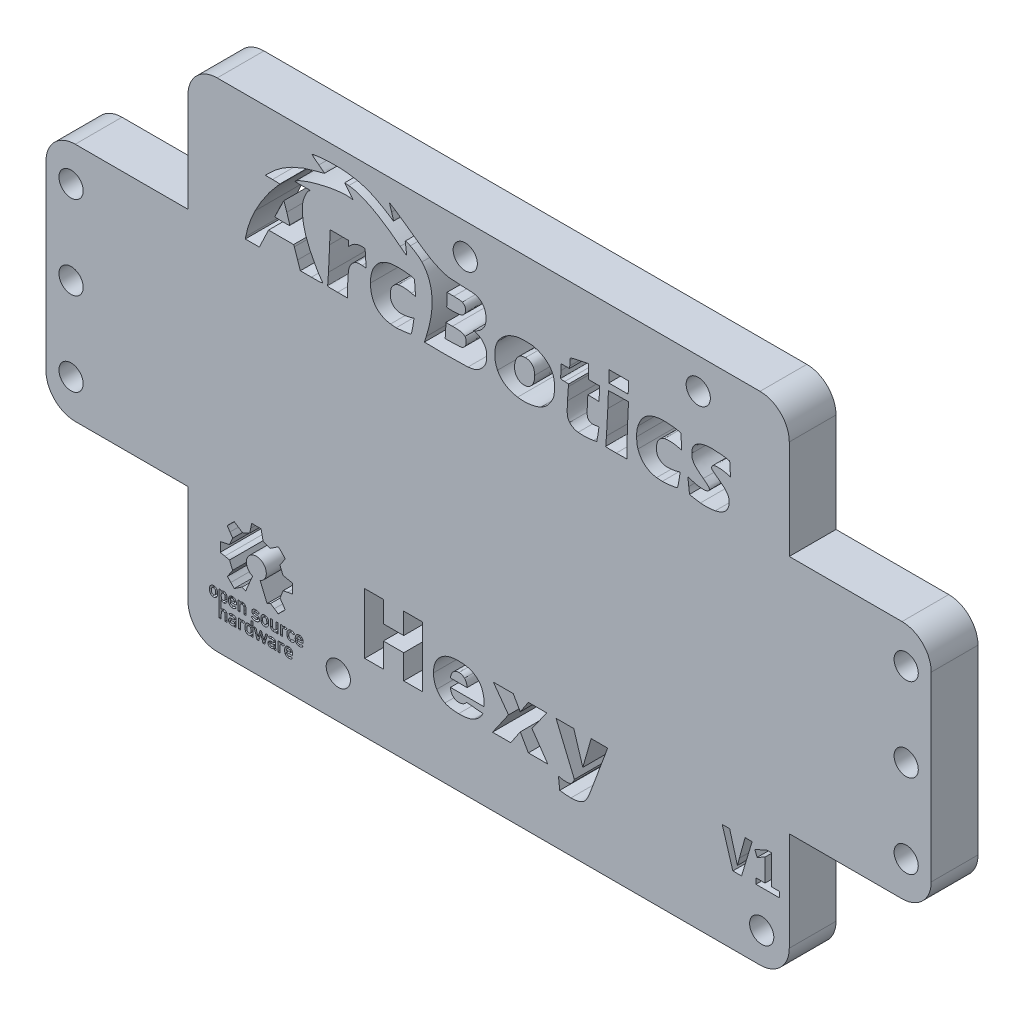
from build123d import *

# Parameters (mm, degrees)
MODEL_R                = 1.45
BOSS_EXTRUDE1_DEPTH    = 5.6
BOSS_EXTRUDE1_2_DEPTH  = 5.6
BOSS_EXTRUDE1_3_DEPTH  = 5.6
BOSS_EXTRUDE1_4_DEPTH  = 5.6
BOSS_EXTRUDE1_5_DEPTH  = 5.6
BOSS_EXTRUDE1_6_DEPTH  = 5.6
BOSS_EXTRUDE1_7_DEPTH  = 5.6
BOSS_EXTRUDE1_8_DEPTH  = 5.6
BOSS_EXTRUDE1_9_DEPTH  = 5.6
BOSS_EXTRUDE1_10_DEPTH = 5.6
BOSS_EXTRUDE1_11_DEPTH = 5.6
BOSS_EXTRUDE1_12_DEPTH = 5.6
BOSS_EXTRUDE1_13_DEPTH = 5.6
BOSS_EXTRUDE1_14_DEPTH = 5.6
BOSS_EXTRUDE1_15_DEPTH = 5.6
CUT_EXTRUDE1_DEPTH     = 5.6
FILLET1_R              = 3.5


with BuildPart() as part:
    # Model → Boss-Extrude1 (new body)
    with BuildSketch(Plane.XY):
        Polygon((653.4922175, 464.272333), (636.4922175, 464.272333), (636.4922175, 479.647333), (564.4922175, 479.647333), (564.4922175, 464.272333), (547.4922175, 464.272333), (547.4922175, 435.522333), (564.4922175, 435.522333), (564.4922175, 420.147333), (636.4922175, 420.147333), (636.4922175, 435.522333), (653.4922175, 435.522333), align=None)
        with BuildLine():
            Line((570.050639, 423.880087), (570.001778, 423.832728))
            add(Edge.make_bspline(
                [(569.902379, 423.770876), (569.930174, 423.778848), (569.974904, 423.806682), (570.001778, 423.832728)],
                knots=[0, 0, 0, 0, 1, 1, 1, 1], degree=3))
            add(Edge.make_bspline(
                [(569.589312, 423.777642), (569.65536, 423.754083), (569.830615, 423.750295), (569.902379, 423.770876)],
                knots=[0, 0, 0, 0, 1, 1, 1, 1], degree=3))
            add(Edge.make_bspline(
                [(569.381774, 423.949909), (569.422474, 423.868234), (569.488133, 423.813734), (569.589312, 423.777642)],
                knots=[0, 0, 0, 0, 1, 1, 1, 1], degree=3))
            add(Edge.make_bspline(
                [(569.436111, 424.337761), (569.334442, 424.232148), (569.313965, 424.085984), (569.381774, 423.949909)],
                knots=[0, 0, 0, 0, 1, 1, 1, 1], degree=3))
            add(Edge.make_bspline(
                [(569.854322, 424.449169), (569.604094, 424.449169), (569.522411, 424.427409), (569.436111, 424.337761)],
                knots=[0, 0, 0, 0, 1, 1, 1, 1], degree=3))
            Line((569.854322, 424.449169), (570.050639, 424.449169))
            Line((570.050639, 424.449169), (570.050639, 424.535622))
            add(Edge.make_bspline(
                [(569.775102, 424.725832), (569.97499, 424.73866), (570.050639, 424.686437), (570.050639, 424.535622)],
                knots=[0, 0, 0, 0, 1, 1, 1, 1], degree=3))
            add(Edge.make_bspline(
                [(569.622945, 424.687172), (569.654611, 424.710584), (569.694183, 424.720638), (569.775102, 424.725832)],
                knots=[0, 0, 0, 0, 1, 1, 1, 1], degree=3))
            add(Edge.make_bspline(
                [(569.622945, 424.687172), (569.599406, 424.66977), (569.576278, 424.655531), (569.566819, 424.655531), (569.525879, 424.683519), (569.480572, 424.717726)],
                knots=[0, 0, 0, 0, 1, 1, 2.000211461, 2.000211461, 2.000211461, 2.000211461], degree=3))
            Line((569.480572, 424.717726), (569.398195, 424.779922))
            Line((569.398195, 424.779922), (569.459637, 424.834447))
            add(Edge.make_bspline(
                [(569.459637, 424.834447), (569.545558, 424.910696), (569.629425, 424.935594), (570.038572, 424.935594), (570.17261, 424.875194), (570.235864, 424.739338)],
                knots=[0, 0, 0, 0, 1, 1, 2.393876452, 2.393876452, 2.393876452, 2.393876452], degree=3))
            add(Edge.make_bspline(
                [(570.271597, 424.217012), (570.271455, 424.657333), (570.271008, 424.663856), (570.235864, 424.739338)],
                knots=[0, 0, 0, 0, 1, 1, 1, 1], degree=3))
            Line((570.271597, 424.217012), (570.271741, 423.771123))
            Line((570.271741, 423.771123), (570.050639, 423.771123))
            Line((570.050639, 423.771123), (570.050639, 423.880087))
        make_face(mode=Mode.SUBTRACT)
        with BuildLine():
            Line((568.237601, 423.771123), (568.237601, 426.778112))
            Line((568.237601, 426.778112), (568.473443, 426.778112))
            Line((568.473443, 426.778112), (568.473443, 426.662184))
            Line((568.473443, 426.662184), (568.54791, 426.712297))
            add(Edge.make_bspline(
                [(568.895191, 426.771074), (568.76352, 426.810176), (568.669783, 426.794311), (568.54791, 426.712297)],
                knots=[0, 0, 0, 0, 1, 1, 1, 1], degree=3))
            add(Edge.make_bspline(
                [(569.124399, 426.575395), (569.080274, 426.664994), (568.988462, 426.743375), (568.895191, 426.771074)],
                knots=[0, 0, 0, 0, 1, 1, 1, 1], degree=3))
            add(Edge.make_bspline(
                [(569.124399, 426.575395), (569.157205, 426.50878), (569.15886, 426.490552), (569.15886, 425.901201), (569.157205, 425.882972), (569.124399, 425.816357)],
                knots=[0, 0, 0, 0, 1, 1, 1.999996606, 1.999996606, 1.999996606, 1.999996606], degree=3))
            add(Edge.make_bspline(
                [(569.124399, 425.816357), (569.062181, 425.690019), (568.91498, 425.5989), (568.708795, 425.5989), (568.593225, 425.643699), (568.526774, 425.694383)],
                knots=[0, 0, 0, 0, 1, 1, 1.453224886, 1.453224886, 1.453224886, 1.453224886], degree=3))
            Line((568.526774, 425.694383), (568.473443, 425.735061))
            Line((568.473443, 425.735061), (568.473443, 424.80434))
            Line((568.473443, 424.80434), (568.513979, 424.842485))
            add(Edge.make_bspline(
                [(568.513979, 424.842485), (568.582306, 424.906781), (568.662004, 424.934947), (568.935759, 424.934947), (569.05027, 424.865735), (569.126877, 424.722642)],
                knots=[0, 0, 0, 0, 1, 1, 2.40956061, 2.40956061, 2.40956061, 2.40956061], degree=3))
            add(Edge.make_bspline(
                [(569.163342, 424.217012), (569.159072, 424.641785), (569.157345, 424.66573), (569.126877, 424.722642)],
                knots=[0, 0, 0, 0, 1, 1, 1, 1], degree=3))
            Line((569.163342, 424.217012), (569.167824, 423.771123))
            Line((569.167824, 423.771123), (568.946913, 423.771123))
            Line((568.946913, 423.771123), (568.942335, 424.158051))
            add(Edge.make_bspline(
                [(568.908278, 424.59503), (568.935377, 424.549023), (568.938128, 424.513726), (568.942335, 424.158051)],
                knots=[0, 0, 0, 0, 1, 1, 1, 1], degree=3))
            add(Edge.make_bspline(
                [(568.908278, 424.59503), (568.858649, 424.679286), (568.80805, 424.707122), (568.633944, 424.707122), (568.603113, 424.699731), (568.567387, 424.674247)],
                knots=[0, 0, 0, 0, 1, 1, 1.681696127, 1.681696127, 1.681696127, 1.681696127], degree=3))
            add(Edge.make_bspline(
                [(568.473443, 424.155824), (568.473443, 424.581905), (568.478715, 424.610997), (568.567387, 424.674247)],
                knots=[0, 0, 0, 0, 1, 1, 1, 1], degree=3))
            Line((568.473443, 424.155824), (568.473443, 423.771123))
            Line((568.473443, 423.771123), (568.237601, 423.771123))
        make_face(mode=Mode.SUBTRACT)
        with BuildLine():
            Line((570.537063, 423.771123), (570.537063, 424.935594))
            Line((570.537063, 424.935594), (570.772906, 424.935594))
            Line((570.772906, 424.935594), (570.772906, 424.799879))
            Line((570.772906, 424.799879), (570.827109, 424.84747))
            add(Edge.make_bspline(
                [(570.827109, 424.84747), (570.902921, 424.914034), (570.963303, 424.935594), (571.166405, 424.935594), (571.215662, 424.92244), (571.285057, 424.87921)],
                knots=[0, 0, 0, 0, 1, 1, 1.836215859, 1.836215859, 1.836215859, 1.836215859], degree=3))
            Line((571.285057, 424.87921), (571.318154, 424.858592))
            Line((571.318154, 424.858592), (571.274748, 424.804967))
            add(Edge.make_bspline(
                [(571.19592, 424.708096), (571.215402, 424.731881), (571.250875, 424.775474), (571.274748, 424.804967)],
                knots=[0, 0, 0, 0, 1, 1, 1, 1], degree=3))
            Line((571.19592, 424.708096), (571.160497, 424.664849))
            Line((571.160497, 424.664849), (571.104658, 424.691346))
            add(Edge.make_bspline(
                [(570.863934, 424.674967), (570.920602, 424.716496), (571.035225, 424.724295), (571.104658, 424.691346)],
                knots=[0, 0, 0, 0, 1, 1, 1, 1], degree=3))
            add(Edge.make_bspline(
                [(570.772929, 424.158051), (570.772954, 424.581871), (570.778294, 424.612207), (570.863934, 424.674967)],
                knots=[0, 0, 0, 0, 1, 1, 1, 1], degree=3))
            Line((570.772929, 424.158051), (570.772906, 423.771123))
            Line((570.772906, 423.771123), (570.537063, 423.771123))
        make_face(mode=Mode.SUBTRACT)
        with BuildLine():
            Line((572.040558, 423.892543), (571.989061, 423.853264))
            add(Edge.make_bspline(
                [(571.57528, 423.784247), (571.6983, 423.728372), (571.86087, 423.755488), (571.989061, 423.853264)],
                knots=[0, 0, 0, 0, 1, 1, 1, 1], degree=3))
            add(Edge.make_bspline(
                [(571.375892, 423.981062), (571.41432, 423.894902), (571.484778, 423.825353), (571.57528, 423.784247)],
                knots=[0, 0, 0, 0, 1, 1, 1, 1], degree=3))
            add(Edge.make_bspline(
                [(571.340916, 424.338618), (571.341302, 424.077176), (571.343628, 424.053403), (571.375892, 423.981062)],
                knots=[0, 0, 0, 0, 1, 1, 1, 1], degree=3))
            add(Edge.make_bspline(
                [(571.436392, 424.807008), (571.350372, 424.709285), (571.34044, 424.660561), (571.340916, 424.338618)],
                knots=[0, 0, 0, 0, 1, 1, 1, 1], degree=3))
            add(Edge.make_bspline(
                [(571.436392, 424.807008), (571.517926, 424.899636), (571.597659, 424.935594), (571.825913, 424.935594), (571.895157, 424.910135), (571.992653, 424.835907)],
                knots=[0, 0, 0, 0, 1, 1, 1.842883325, 1.842883325, 1.842883325, 1.842883325], degree=3))
            Line((571.992653, 424.835907), (572.040558, 424.799434))
            Line((572.040558, 424.799434), (572.040558, 425.407279))
            Line((572.040558, 425.407279), (572.26166, 425.407279))
            Line((572.26166, 425.407279), (572.26166, 423.771123))
            Line((572.26166, 423.771123), (572.040558, 423.771123))
            Line((572.040558, 423.771123), (572.040558, 423.892543))
        make_face(mode=Mode.SUBTRACT)
        with BuildLine():
            Line((573.21977, 424.581816), (573.093046, 424.180148))
            Line((573.093046, 424.180148), (572.973692, 423.778483))
            Line((572.973692, 423.778483), (572.76845, 423.769935))
            Line((572.76845, 423.769935), (572.61588, 424.245894))
            add(Edge.make_bspline(
                [(572.429778, 424.829308), (572.448221, 424.770213), (572.531967, 424.50768), (572.61588, 424.245894)],
                knots=[0, 0, 0, 0, 1, 1, 1, 1], degree=3))
            Line((572.429778, 424.829308), (572.396246, 424.936755))
            Line((572.396246, 424.936755), (572.516668, 424.932489))
            Line((572.516668, 424.932489), (572.63709, 424.928224))
            Line((572.63709, 424.928224), (572.747863, 424.527415))
            add(Edge.make_bspline(
                [(572.866472, 424.119138), (572.862162, 424.123245), (572.808788, 424.30697), (572.747863, 424.527415)],
                knots=[0, 0, 0, 0, 1, 1, 1, 1], degree=3))
            add(Edge.make_bspline(
                [(573.006503, 424.52348), (572.933795, 424.296985), (572.870781, 424.115032), (572.866472, 424.119138)],
                knots=[0, 0, 0, 0, 1, 1, 1, 1], degree=3))
            Line((573.006503, 424.52348), (573.138699, 424.93529))
            Line((573.138699, 424.93529), (573.21977, 424.935378))
            Line((573.21977, 424.935378), (573.30084, 424.935466))
            Line((573.30084, 424.935466), (573.43346, 424.522802))
            add(Edge.make_bspline(
                [(573.573491, 424.110196), (573.569414, 424.110163), (573.5064, 424.295836), (573.43346, 424.522802)],
                knots=[0, 0, 0, 0, 1, 1, 1, 1], degree=3))
            add(Edge.make_bspline(
                [(573.573491, 424.110196), (573.577568, 424.110226), (573.630362, 424.293372), (573.75126, 424.740988), (573.808262, 424.926999), (573.817481, 424.930537)],
                knots=[0, 0, 0, 0, 1, 1, 2, 2, 2, 2], degree=3))
            add(Edge.make_bspline(
                [(573.938392, 424.932592), (573.881111, 424.934999), (573.826701, 424.934074), (573.817481, 424.930537)],
                knots=[0, 0, 0, 0, 1, 1, 1, 1], degree=3))
            Line((573.938392, 424.932592), (574.041983, 424.928214))
            Line((574.041983, 424.928214), (573.881001, 424.42705))
            add(Edge.make_bspline(
                [(573.696862, 423.847878), (573.709599, 423.890782), (573.792461, 424.151409), (573.881001, 424.42705)],
                knots=[0, 0, 0, 0, 1, 1, 1, 1], degree=3))
            Line((573.696862, 423.847878), (573.673705, 423.769871))
            Line((573.673705, 423.769871), (573.465761, 423.778483))
            Line((573.465761, 423.778483), (573.346728, 424.180152))
            Line((573.346728, 424.180152), (573.21977, 424.581816))
        make_face(mode=Mode.SUBTRACT)
        with BuildLine():
            add(Edge.make_bspline(
                [(567.419523, 425.619519), (567.605599, 425.560671), (567.824121, 425.633717), (567.938622, 425.79304)],
                knots=[0, 0, 0, 0, 1, 1, 1, 1], degree=3))
            add(Edge.make_bspline(
                [(567.200261, 425.762108), (567.271638, 425.682721), (567.320826, 425.650733), (567.419523, 425.619519)],
                knots=[0, 0, 0, 0, 1, 1, 1, 1], degree=3))
            add(Edge.make_bspline(
                [(567.200261, 425.762108), (567.104452, 425.868672), (567.081237, 425.953274), (567.081237, 426.442996), (567.10421, 426.524129), (567.205592, 426.635057)],
                knots=[0, 0, 0, 0, 1, 1, 2.018623095, 2.018623095, 2.018623095, 2.018623095], degree=3))
            add(Edge.make_bspline(
                [(567.552184, 426.784608), (567.396519, 426.783454), (567.305211, 426.744055), (567.205592, 426.635057)],
                knots=[0, 0, 0, 0, 1, 1, 1, 1], degree=3))
            add(Edge.make_bspline(
                [(567.835513, 426.701336), (567.734766, 426.76931), (567.679505, 426.785551), (567.552184, 426.784608)],
                knots=[0, 0, 0, 0, 1, 1, 1, 1], degree=3))
            add(Edge.make_bspline(
                [(567.835513, 426.701336), (567.974184, 426.607774), (568.031239, 426.460431), (568.031239, 426.000638), (568.004625, 425.884878), (567.938622, 425.79304)],
                knots=[0, 0, 0, 0, 1, 1, 1.73798643, 1.73798643, 1.73798643, 1.73798643], degree=3))
        make_face(mode=Mode.SUBTRACT)
        with BuildLine():
            Line((569.564214, 426.114805), (569.564214, 426.065533))
            add(Edge.make_bspline(
                [(569.690611, 425.85341), (569.623501, 425.8916), (569.564214, 425.991097), (569.564214, 426.065533)],
                knots=[0, 0, 0, 0, 1, 1, 1, 1], degree=3))
            add(Edge.make_bspline(
                [(570.080813, 425.901701), (569.989325, 425.818906), (569.793774, 425.794705), (569.690611, 425.85341)],
                knots=[0, 0, 0, 0, 1, 1, 1, 1], degree=3))
            add(Edge.make_bspline(
                [(570.179731, 425.860355), (570.113069, 425.915445), (570.101393, 425.920326), (570.080813, 425.901701)],
                knots=[0, 0, 0, 0, 1, 1, 1, 1], degree=3))
            add(Edge.make_bspline(
                [(570.256158, 425.787434), (570.255694, 425.793186), (570.221302, 425.826001), (570.179731, 425.860355)],
                knots=[0, 0, 0, 0, 1, 1, 1, 1], degree=3))
            add(Edge.make_bspline(
                [(570.084448, 425.655208), (570.170214, 425.696219), (570.258058, 425.763863), (570.256158, 425.787434)],
                knots=[0, 0, 0, 0, 1, 1, 1, 1], degree=3))
            add(Edge.make_bspline(
                [(569.716682, 425.613321), (569.829147, 425.589362), (569.983513, 425.606944), (570.084448, 425.655208)],
                knots=[0, 0, 0, 0, 1, 1, 1, 1], degree=3))
            add(Edge.make_bspline(
                [(569.344378, 426.309907), (569.298463, 425.94269), (569.443384, 425.671541), (569.716682, 425.613321)],
                knots=[0, 0, 0, 0, 1, 1, 1, 1], degree=3))
            add(Edge.make_bspline(
                [(569.815106, 426.785177), (569.554167, 426.784459), (569.381976, 426.610607), (569.344378, 426.309907)],
                knots=[0, 0, 0, 0, 1, 1, 1, 1], degree=3))
            add(Edge.make_bspline(
                [(570.024535, 426.736957), (569.939245, 426.778946), (569.911034, 426.785441), (569.815106, 426.785177)],
                knots=[0, 0, 0, 0, 1, 1, 1, 1], degree=3))
            add(Edge.make_bspline(
                [(570.286481, 426.261654), (570.286481, 426.509179), (570.211741, 426.644796), (570.024535, 426.736957)],
                knots=[0, 0, 0, 0, 1, 1, 1, 1], degree=3))
            Line((570.286481, 426.261654), (570.286481, 426.114805))
            Line((570.286481, 426.114805), (569.564214, 426.114805))
        make_face(mode=Mode.SUBTRACT)
        with BuildLine():
            Line((570.507583, 425.613641), (570.507583, 426.778112))
            Line((570.507583, 426.778112), (570.728685, 426.778112))
            Line((570.728685, 426.778112), (570.728685, 426.639668))
            Line((570.728685, 426.639668), (570.776591, 426.685129))
            add(Edge.make_bspline(
                [(571.386483, 426.565199), (571.276115, 426.802218), (570.964536, 426.863487), (570.776591, 426.685129)],
                knots=[0, 0, 0, 0, 1, 1, 1, 1], degree=3))
            add(Edge.make_bspline(
                [(571.421328, 426.05216), (571.421187, 426.481589), (571.420465, 426.492224), (571.386483, 426.565199)],
                knots=[0, 0, 0, 0, 1, 1, 1, 1], degree=3))
            Line((571.421328, 426.05216), (571.421472, 425.613641))
            Line((571.421472, 425.613641), (571.20037, 425.613641))
            Line((571.20037, 425.613641), (571.200046, 425.993199))
            add(Edge.make_bspline(
                [(571.171422, 426.435099), (571.19695, 426.378863), (571.199754, 426.335585), (571.200046, 425.993199)],
                knots=[0, 0, 0, 0, 1, 1, 1, 1], degree=3))
            add(Edge.make_bspline(
                [(571.171422, 426.435099), (571.133455, 426.518738), (571.068632, 426.556899), (570.860422, 426.556899), (570.7956, 426.518738), (570.757632, 426.435099)],
                knots=[0, 0, 0, 0, 1, 1, 2, 2, 2, 2], degree=3))
            add(Edge.make_bspline(
                [(570.729008, 425.993199), (570.7293, 426.335585), (570.732104, 426.378863), (570.757632, 426.435099)],
                knots=[0, 0, 0, 0, 1, 1, 1, 1], degree=3))
            Line((570.729008, 425.993199), (570.728685, 425.613641))
            Line((570.728685, 425.613641), (570.507583, 425.613641))
        make_face(mode=Mode.SUBTRACT)
        with BuildLine():
            Line((572.893323, 426.472576), (572.809649, 426.518478))
            add(Edge.make_bspline(
                [(572.809649, 426.518478), (572.733174, 426.56043), (572.714348, 426.56438), (572.468146, 426.56438), (572.452234, 426.561097), (572.417657, 426.528645)],
                knots=[0, 0, 0, 0, 1, 1, 1.993619175, 1.993619175, 1.993619175, 1.993619175], degree=3))
            add(Edge.make_bspline(
                [(572.417657, 426.528645), (572.390122, 426.502803), (572.379581, 426.477932), (572.379581, 426.357066), (572.414492, 426.334737), (572.566951, 426.318963)],
                knots=[0, 0, 0, 0, 1, 1, 3.088989982, 3.088989982, 3.088989982, 3.088989982], degree=3))
            add(Edge.make_bspline(
                [(573.009271, 426.156784), (572.938856, 426.263187), (572.873139, 426.287283), (572.566951, 426.318963)],
                knots=[0, 0, 0, 0, 1, 1, 1, 1], degree=3))
            add(Edge.make_bspline(
                [(573.030411, 425.82444), (573.074186, 425.910245), (573.063739, 426.074477), (573.009271, 426.156784)],
                knots=[0, 0, 0, 0, 1, 1, 1, 1], degree=3))
            add(Edge.make_bspline(
                [(572.803301, 425.636802), (572.897497, 425.667864), (572.989173, 425.743606), (573.030411, 425.82444)],
                knots=[0, 0, 0, 0, 1, 1, 1, 1], degree=3))
            add(Edge.make_bspline(
                [(572.468022, 425.607846), (572.537559, 425.59504), (572.726011, 425.611315), (572.803301, 425.636802)],
                knots=[0, 0, 0, 0, 1, 1, 1, 1], degree=3))
            add(Edge.make_bspline(
                [(572.090243, 425.793605), (572.122391, 425.741589), (572.350289, 425.629528), (572.468022, 425.607846)],
                knots=[0, 0, 0, 0, 1, 1, 1, 1], degree=3))
            add(Edge.make_bspline(
                [(572.154619, 425.882122), (572.114141, 425.841644), (572.085172, 425.801811), (572.090243, 425.793605)],
                knots=[0, 0, 0, 0, 1, 1, 1, 1], degree=3))
            Line((572.154619, 425.882122), (572.228217, 425.95572))
            Line((572.228217, 425.95572), (572.290223, 425.910802))
            add(Edge.make_bspline(
                [(572.615425, 425.822236), (572.48029, 425.816099), (572.385212, 425.841993), (572.290223, 425.910802)],
                knots=[0, 0, 0, 0, 1, 1, 1, 1], degree=3))
            add(Edge.make_bspline(
                [(572.828316, 425.928374), (572.803093, 425.857552), (572.743964, 425.828073), (572.615425, 425.822236)],
                knots=[0, 0, 0, 0, 1, 1, 1, 1], degree=3))
            add(Edge.make_bspline(
                [(572.777222, 426.065381), (572.823449, 426.043887), (572.846982, 425.980783), (572.828316, 425.928374)],
                knots=[0, 0, 0, 0, 1, 1, 1, 1], degree=3))
            add(Edge.make_bspline(
                [(572.574019, 426.098276), (572.665702, 426.08952), (572.757143, 426.074718), (572.777222, 426.065381)],
                knots=[0, 0, 0, 0, 1, 1, 1, 1], degree=3))
            add(Edge.make_bspline(
                [(572.242205, 426.200124), (572.301299, 426.146686), (572.407073, 426.114219), (572.574019, 426.098276)],
                knots=[0, 0, 0, 0, 1, 1, 1, 1], degree=3))
            add(Edge.make_bspline(
                [(572.19151, 426.603413), (572.120782, 426.482725), (572.14529, 426.287766), (572.242205, 426.200124)],
                knots=[0, 0, 0, 0, 1, 1, 1, 1], degree=3))
            add(Edge.make_bspline(
                [(572.286523, 426.708452), (572.255609, 426.6871), (572.212853, 426.639832), (572.19151, 426.603413)],
                knots=[0, 0, 0, 0, 1, 1, 1, 1], degree=3))
            add(Edge.make_bspline(
                [(572.286523, 426.708452), (572.350603, 426.752711), (572.489689, 426.792852), (572.722, 426.792852), (572.901305, 426.736781), (572.99739, 426.662005)],
                knots=[0, 0, 0, 0, 1, 1, 2.602224612, 2.602224612, 2.602224612, 2.602224612], degree=3))
            Line((572.99739, 426.662005), (573.032964, 426.634321))
            Line((573.032964, 426.634321), (572.963143, 426.553448))
            Line((572.963143, 426.553448), (572.893323, 426.472576))
        make_face(mode=Mode.SUBTRACT)
        with BuildLine():
            Line((573.212399, 425.959414), (573.212632, 426.195566))
            add(Edge.make_bspline(
                [(573.304417, 426.606198), (573.220655, 426.484918), (573.212883, 426.450146), (573.212632, 426.195566)],
                knots=[0, 0, 0, 0, 1, 1, 1, 1], degree=3))
            add(Edge.make_bspline(
                [(573.88293, 426.747289), (573.675676, 426.836448), (573.420448, 426.774201), (573.304417, 426.606198)],
                knots=[0, 0, 0, 0, 1, 1, 1, 1], degree=3))
            add(Edge.make_bspline(
                [(574.127697, 426.482915), (574.091922, 426.585724), (573.981664, 426.704815), (573.88293, 426.747289)],
                knots=[0, 0, 0, 0, 1, 1, 1, 1], degree=3))
            add(Edge.make_bspline(
                [(574.121729, 425.893076), (574.166813, 426.007748), (574.17038, 426.36025), (574.127697, 426.482915)],
                knots=[0, 0, 0, 0, 1, 1, 1, 1], degree=3))
            add(Edge.make_bspline(
                [(573.707582, 425.604777), (573.893643, 425.61358), (574.056383, 425.726867), (574.121729, 425.893076)],
                knots=[0, 0, 0, 0, 1, 1, 1, 1], degree=3))
            add(Edge.make_bspline(
                [(573.566163, 425.611744), (573.590485, 425.605383), (573.654123, 425.602248), (573.707582, 425.604777)],
                knots=[0, 0, 0, 0, 1, 1, 1, 1], degree=3))
            add(Edge.make_bspline(
                [(573.26097, 425.860753), (573.324824, 425.731047), (573.426165, 425.648363), (573.566163, 425.611744)],
                knots=[0, 0, 0, 0, 1, 1, 1, 1], degree=3))
            Line((573.26097, 425.860753), (573.212399, 425.959414))
        make_face(mode=Mode.SUBTRACT)
        with BuildLine():
            add(Edge.make_bspline(
                [(569.477882528, 431.998521528), (569.459778528, 431.981237528), (569.293652528, 431.944731528), (568.921428528, 431.876243528)],
                knots=[0, 0, 0, 0, 1, 1, 1, 1], degree=3))
            Line((569.477882528, 431.998521528), (569.842687528, 432.838468528))
            add(Edge.make_bspline(
                [(569.524201528, 433.327515528), (569.699368528, 433.072525528), (569.842687528, 432.852454528), (569.842687528, 432.838468528)],
                knots=[0, 0, 0, 0, 1, 1, 1, 1], degree=3))
            add(Edge.make_bspline(
                [(569.197784528, 433.811010528), (569.202147528, 433.800077528), (569.349035528, 433.582504528), (569.524201528, 433.327515528)],
                knots=[0, 0, 0, 0, 1, 1, 1, 1], degree=3))
            add(Edge.make_bspline(
                [(569.197784528, 433.811010528), (569.189031528, 433.832943528), (569.999566528, 434.653430528), (570.039877528, 434.653430528), (570.260265528, 434.507503528), (570.519737528, 434.329147528)],
                knots=[0, 0, 0, 0, 1, 1, 1.325147929, 1.325147929, 1.325147929, 1.325147929], degree=3))
            add(Edge.make_bspline(
                [(571.033389528, 434.004864528), (571.002935528, 434.004864528), (570.862760528, 434.093361528), (570.519737528, 434.329147528)],
                knots=[0, 0, 0, 0, 1, 1, 1, 1], degree=3))
            Line((571.033389528, 434.004864528), (571.87694539, 434.370978))
            add(Edge.make_bspline(
                [(572.00265039, 434.943782), (571.93055239, 434.551176), (571.89533839, 434.390716), (571.87694539, 434.370978)],
                knots=[0, 0, 0, 0, 1, 1, 1, 1], degree=3))
            add(Edge.make_bspline(
                [(572.11511339, 435.522333), (572.10834439, 435.504092), (572.05773539, 435.243744), (572.00265039, 434.943782)],
                knots=[0, 0, 0, 0, 1, 1, 1, 1], degree=3))
            Line((572.11511339, 435.522333), (573.24592661, 435.522333))
            add(Edge.make_bspline(
                [(573.36375661, 434.937899), (573.30549161, 435.249204), (573.25246761, 435.512199), (573.24592661, 435.522333)],
                knots=[0, 0, 0, 0, 1, 1, 1, 1], degree=3))
            add(Edge.make_bspline(
                [(573.49004061, 434.351544), (573.47813261, 434.363452), (573.42575561, 434.606647), (573.36375661, 434.937899)],
                knots=[0, 0, 0, 0, 1, 1, 1, 1], degree=3))
            Line((573.49004061, 434.351544), (574.307726365, 434.030010811))
            add(Edge.make_bspline(
                [(574.812785365, 434.348948811), (574.488199365, 434.126370811), (574.335608365, 434.030010811), (574.307726365, 434.030010811)],
                knots=[0, 0, 0, 0, 1, 1, 1, 1], degree=3))
            add(Edge.make_bspline(
                [(575.306386365, 434.675337811), (575.290714365, 434.671239811), (575.068593365, 434.524363811), (574.812785365, 434.348948811)],
                knots=[0, 0, 0, 0, 1, 1, 1, 1], degree=3))
            add(Edge.make_bspline(
                [(575.738756365, 434.279114811), (575.426859365, 434.590856811), (575.328391365, 434.681091811), (575.306386365, 434.675337811)],
                knots=[0, 0, 0, 0, 1, 1, 1, 1], degree=3))
            add(Edge.make_bspline(
                [(575.738756365, 434.279114811), (575.960887365, 434.057093811), (576.142630365, 433.865073811), (576.142630365, 433.839732811), (576.000182365, 433.621559811), (575.826079365, 433.367574811)],
                knots=[0, 0, 0, 0, 1, 1, 1.99992108, 1.99992108, 1.99992108, 1.99992108], degree=3))
            add(Edge.make_bspline(
                [(575.501031365, 432.879010811), (575.505705365, 432.893736811), (575.651977365, 433.113589811), (575.826079365, 433.367574811)],
                knots=[0, 0, 0, 0, 1, 1, 1, 1], degree=3))
            Line((575.501031365, 432.879010811), (575.869862472, 432.002561528))
            add(Edge.make_bspline(
                [(576.439612472, 431.878467528), (576.059454472, 431.948157528), (575.886845472, 431.985752528), (575.869862472, 432.002561528)],
                knots=[0, 0, 0, 0, 1, 1, 1, 1], degree=3))
            add(Edge.make_bspline(
                [(577.003422472, 431.764430528), (576.993289472, 431.772162528), (576.739574472, 431.823479528), (576.439612472, 431.878467528)],
                knots=[0, 0, 0, 0, 1, 1, 1, 1], degree=3))
            Line((577.003422472, 431.764430528), (577.003422472, 430.634430528))
            add(Edge.make_bspline(
                [(576.421324044, 430.517052972), (576.731911501, 430.57566632), (576.993855163, 430.628486481), (577.003422472, 430.634430528)],
                knots=[0, 0, 0, 0, 1, 1, 1, 1], degree=3))
            add(Edge.make_bspline(
                [(575.864035044, 430.397466972), (575.874388044, 430.408065972), (576.125168044, 430.461879972), (576.421324044, 430.517052972)],
                knots=[0, 0, 0, 0, 1, 1, 1, 1], degree=3))
            Line((575.864035044, 430.397466972), (575.521838337, 429.46971194))
            add(Edge.make_bspline(
                [(575.833030337, 429.00638694), (575.669820337, 429.24383994), (575.529784337, 429.45233694), (575.521838337, 429.46971194)],
                knots=[0, 0, 0, 0, 1, 1, 1, 1], degree=3))
            add(Edge.make_bspline(
                [(575.833030337, 429.00638694), (575.996241337, 428.76893294), (576.129776337, 428.56658094), (576.129776337, 428.52635694), (575.309272337, 427.71581494), (575.287356337, 427.72452194)],
                knots=[0, 0, 0, 0, 1, 1, 4.076619033, 4.076619033, 4.076619033, 4.076619033], degree=3))
            add(Edge.make_bspline(
                [(575.287356337, 427.72452194), (575.276423337, 427.72886494), (575.073453337, 427.86580294), (574.599169337, 428.19185494), (574.391418337, 428.32523994), (574.374643337, 428.32523994)],
                knots=[0, 0, 0, 0, 1, 1, 2, 2, 2, 2], degree=3))
            Line((574.374643337, 428.32523994), (573.965252119, 428.125639748))
            Line((573.965252119, 428.125639748), (573.134729992, 430.096843246))
            ThreePointArc((573.134729992, 430.096843246), (572.68052, 432.39190922), (572.226310008, 430.096843246))
            Line((572.226310008, 430.096843246), (571.395787881, 428.125639748))
            Line((571.395787881, 428.125639748), (570.972257528, 428.332133528))
            add(Edge.make_bspline(
                [(570.972257528, 428.332133528), (570.956645528, 428.332133528), (570.745531528, 428.196155528), (570.260701528, 427.863765528), (570.055640528, 427.727787528), (570.039211528, 427.727787528), (569.847506528, 427.912859528), (569.621415528, 428.139058528)],
                knots=[0, 0, 0, 0, 1, 1, 2, 2, 2.999878271, 2.999878271, 2.999878271, 2.999878271], degree=3))
            add(Edge.make_bspline(
                [(569.218719528, 428.572165528), (569.213088528, 428.557488528), (569.345114528, 428.415492528), (569.621415528, 428.139058528)],
                knots=[0, 0, 0, 0, 1, 1, 1, 1], degree=3))
            add(Edge.make_bspline(
                [(569.218719528, 428.572165528), (569.223328528, 428.584174528), (569.363583528, 428.793009528), (569.697211528, 429.279475528), (569.833695528, 429.489183528), (569.833695528, 429.502259528)],
                knots=[0, 0, 0, 0, 1, 1, 2, 2, 2, 2], degree=3))
            Line((569.833695528, 429.502259528), (569.471601528, 430.396551528))
            add(Edge.make_bspline(
                [(568.910350528, 430.514460528), (569.207629528, 430.459078528), (569.460192528, 430.406019528), (569.471601528, 430.396551528)],
                knots=[0, 0, 0, 0, 1, 1, 1, 1], degree=3))
            add(Edge.make_bspline(
                [(568.357617528, 430.634430528), (568.365121528, 430.622598528), (568.578574528, 430.576269528), (568.910350528, 430.514460528)],
                knots=[0, 0, 0, 0, 1, 1, 1, 1], degree=3))
            Line((568.357617528, 430.634430528), (568.357617528, 431.764430528))
            add(Edge.make_bspline(
                [(568.921428528, 431.876243528), (568.629573528, 431.822542528), (568.375858528, 431.772226528), (568.357617528, 431.764430528)],
                knots=[0, 0, 0, 0, 1, 1, 1, 1], degree=3))
        make_face(mode=Mode.SUBTRACT)
        with BuildLine():
            Line((574.782225, 423.879819), (574.741689, 423.840993))
            add(Edge.make_bspline(
                [(574.646352, 423.779275), (574.676493, 423.791865), (574.719395, 423.819639), (574.741689, 423.840993)],
                knots=[0, 0, 0, 0, 1, 1, 1, 1], degree=3))
            add(Edge.make_bspline(
                [(574.320898, 423.777642), (574.39829, 423.750036), (574.578521, 423.75094), (574.646352, 423.779275)],
                knots=[0, 0, 0, 0, 1, 1, 1, 1], degree=3))
            add(Edge.make_bspline(
                [(574.074842, 424.106934), (574.075129, 423.95146), (574.162896, 423.834003), (574.320898, 423.777642)],
                knots=[0, 0, 0, 0, 1, 1, 1, 1], degree=3))
            add(Edge.make_bspline(
                [(574.25895, 424.409776), (574.137355, 424.344591), (574.074593, 424.241354), (574.074842, 424.106934)],
                knots=[0, 0, 0, 0, 1, 1, 1, 1], degree=3))
            add(Edge.make_bspline(
                [(574.5517, 424.446601), (574.346894, 424.442031), (574.310601, 424.437466), (574.25895, 424.409776)],
                knots=[0, 0, 0, 0, 1, 1, 1, 1], degree=3))
            Line((574.5517, 424.446601), (574.78549, 424.451818))
            Line((574.78549, 424.451818), (574.779527, 424.54547))
            add(Edge.make_bspline(
                [(574.746204, 424.669354), (574.76494, 424.648652), (574.775444, 424.609602), (574.779527, 424.54547)],
                knots=[0, 0, 0, 0, 1, 1, 1, 1], degree=3))
            add(Edge.make_bspline(
                [(574.327876, 424.666046), (574.396936, 424.749322), (574.671867, 424.751496), (574.746204, 424.669354)],
                knots=[0, 0, 0, 0, 1, 1, 1, 1], degree=3))
            add(Edge.make_bspline(
                [(574.219453, 424.711557), (574.298896, 424.649864), (574.310438, 424.645019), (574.327876, 424.666046)],
                knots=[0, 0, 0, 0, 1, 1, 1, 1], degree=3))
            Line((574.219453, 424.711557), (574.130545, 424.7806))
            Line((574.130545, 424.7806), (574.191959, 424.8351))
            add(Edge.make_bspline(
                [(574.567011, 424.933442), (574.369432, 424.939714), (574.284853, 424.917536), (574.191959, 424.8351)],
                knots=[0, 0, 0, 0, 1, 1, 1, 1], degree=3))
            add(Edge.make_bspline(
                [(574.819671, 424.883755), (574.741212, 424.92388), (574.716766, 424.928688), (574.567011, 424.933442)],
                knots=[0, 0, 0, 0, 1, 1, 1, 1], degree=3))
            add(Edge.make_bspline(
                [(574.951245, 424.767051), (574.917045, 424.82234), (574.886114, 424.849774), (574.819671, 424.883755)],
                knots=[0, 0, 0, 0, 1, 1, 1, 1], degree=3))
            Line((574.951245, 424.767051), (574.995957, 424.694771))
            Line((574.995957, 424.694771), (575.004879, 423.771123))
            Line((575.004879, 423.771123), (574.782225, 423.771123))
            Line((574.782225, 423.771123), (574.782225, 423.879819))
        make_face(mode=Mode.SUBTRACT)
        with BuildLine():
            Line((575.268649, 423.771123), (575.268649, 424.935594))
            Line((575.268649, 424.935594), (575.504492, 424.935594))
            Line((575.504492, 424.935594), (575.504492, 424.79715))
            Line((575.504492, 424.79715), (575.552397, 424.843514))
            add(Edge.make_bspline(
                [(575.552397, 424.843514), (575.619729, 424.908681), (575.69405, 424.935594), (575.881121, 424.935594), (575.920525, 424.926944), (575.977417, 424.898115)],
                knots=[0, 0, 0, 0, 1, 1, 1.660919285, 1.660919285, 1.660919285, 1.660919285], degree=3))
            Line((575.977417, 424.898115), (576.051378, 424.860636))
            Line((576.051378, 424.860636), (575.975215, 424.769139))
            add(Edge.make_bspline(
                [(575.975215, 424.769139), (575.933326, 424.718815), (575.893639, 424.67558), (575.880407, 424.670542), (575.854974, 424.678833), (575.830506, 424.691486)],
                knots=[0, 0, 0, 0, 1, 1, 2, 2, 2, 2], degree=3))
            add(Edge.make_bspline(
                [(575.537951, 424.612816), (575.599982, 424.70567), (575.733596, 424.7416), (575.830506, 424.691486)],
                knots=[0, 0, 0, 0, 1, 1, 1, 1], degree=3))
            add(Edge.make_bspline(
                [(575.504492, 424.166927), (575.504492, 424.553883), (575.50524, 424.56385), (575.537951, 424.612816)],
                knots=[0, 0, 0, 0, 1, 1, 1, 1], degree=3))
            Line((575.504492, 424.166927), (575.504492, 423.771123))
            Line((575.504492, 423.771123), (575.268649, 423.771123))
        make_face(mode=Mode.SUBTRACT)
        with BuildLine():
            Line((576.993878, 423.937265), (576.933417, 423.882643))
            add(Edge.make_bspline(
                [(576.602632, 423.76171), (576.756269, 423.76752), (576.839787, 423.798053), (576.933417, 423.882643)],
                knots=[0, 0, 0, 0, 1, 1, 1, 1], degree=3))
            add(Edge.make_bspline(
                [(576.411011, 423.776171), (576.448159, 423.7639), (576.519048, 423.75855), (576.602632, 423.76171)],
                knots=[0, 0, 0, 0, 1, 1, 1, 1], degree=3))
            add(Edge.make_bspline(
                [(576.132571, 424.002549), (576.184333, 423.899669), (576.285057, 423.817779), (576.411011, 423.776171)],
                knots=[0, 0, 0, 0, 1, 1, 1, 1], degree=3))
            add(Edge.make_bspline(
                [(576.086882, 424.549129), (576.046626, 424.37838), (576.067177, 424.132524), (576.132571, 424.002549)],
                knots=[0, 0, 0, 0, 1, 1, 1, 1], degree=3))
            add(Edge.make_bspline(
                [(576.355889, 424.902397), (576.212143, 424.836588), (576.128874, 424.727237), (576.086882, 424.549129)],
                knots=[0, 0, 0, 0, 1, 1, 1, 1], degree=3))
            add(Edge.make_bspline(
                [(576.563526, 424.932599), (576.450852, 424.93831), (576.426639, 424.934788), (576.355889, 424.902397)],
                knots=[0, 0, 0, 0, 1, 1, 1, 1], degree=3))
            add(Edge.make_bspline(
                [(577.022726, 424.379742), (577.022726, 424.725399), (576.863245, 424.917408), (576.563526, 424.932599)],
                knots=[0, 0, 0, 0, 1, 1, 1, 1], degree=3))
            Line((577.022726, 424.379742), (577.022726, 424.257547))
            Line((577.022726, 424.257547), (576.287573, 424.257547))
            Line((576.287573, 424.257547), (576.29593, 424.202272))
            add(Edge.make_bspline(
                [(576.77312, 424.031471), (576.569844, 423.896949), (576.329062, 423.983132), (576.29593, 424.202272)],
                knots=[0, 0, 0, 0, 1, 1, 1, 1], degree=3))
            add(Edge.make_bspline(
                [(576.932329, 423.99054), (576.838559, 424.071706), (576.835217, 424.072565), (576.77312, 424.031471)],
                knots=[0, 0, 0, 0, 1, 1, 1, 1], degree=3))
            Line((576.932329, 423.99054), (576.993878, 423.937265))
        make_face(mode=Mode.SUBTRACT)
        with BuildLine():
            Line((575.062287, 425.732951), (575.005365, 425.687207))
            add(Edge.make_bspline(
                [(574.654939, 425.614953), (574.769217, 425.581833), (574.910488, 425.610961), (575.005365, 425.687207)],
                knots=[0, 0, 0, 0, 1, 1, 1, 1], degree=3))
            add(Edge.make_bspline(
                [(574.422331, 425.805262), (574.469996, 425.72026), (574.567864, 425.64019), (574.654939, 425.614953)],
                knots=[0, 0, 0, 0, 1, 1, 1, 1], degree=3))
            Line((574.422331, 425.805262), (574.376871, 425.886333))
            Line((574.376871, 425.886333), (574.372389, 426.332222))
            Line((574.372389, 426.332222), (574.367907, 426.778112))
            Line((574.367907, 426.778112), (574.590603, 426.778112))
            Line((574.590603, 426.778112), (574.590603, 426.432444))
            add(Edge.make_bspline(
                [(574.673251, 425.892174), (574.600684, 425.962509), (574.590603, 426.028411), (574.590603, 426.432444)],
                knots=[0, 0, 0, 0, 1, 1, 1, 1], degree=3))
            add(Edge.make_bspline(
                [(574.673251, 425.892174), (574.722479, 425.844461), (574.729992, 425.842113), (574.928884, 425.842113), (574.946754, 425.846563), (574.98143, 425.878963)],
                knots=[0, 0, 0, 0, 1, 1, 1.922516287, 1.922516287, 1.922516287, 1.922516287], degree=3))
            add(Edge.make_bspline(
                [(575.062287, 426.386766), (575.062287, 425.964948), (575.060336, 425.952691), (574.98143, 425.878963)],
                knots=[0, 0, 0, 0, 1, 1, 1, 1], degree=3))
            Line((575.062287, 426.386766), (575.062287, 426.778112))
            Line((575.062287, 426.778112), (575.29813, 426.778112))
            Line((575.29813, 426.778112), (575.29813, 425.613641))
            Line((575.29813, 425.613641), (575.062287, 425.613641))
            Line((575.062287, 425.613641), (575.062287, 425.732951))
        make_face(mode=Mode.SUBTRACT)
        with BuildLine():
            Line((577.259764, 425.795032), (577.19829, 425.739494))
            add(Edge.make_bspline(
                [(576.699643, 425.621378), (576.869043, 425.573846), (577.066783, 425.620685), (577.19829, 425.739494)],
                knots=[0, 0, 0, 0, 1, 1, 1, 1], degree=3))
            add(Edge.make_bspline(
                [(576.379738, 425.900626), (576.446075, 425.755362), (576.552159, 425.66276), (576.699643, 425.621378)],
                knots=[0, 0, 0, 0, 1, 1, 1, 1], degree=3))
            add(Edge.make_bspline(
                [(576.391692, 426.51794), (576.313496, 426.363786), (576.307586, 426.058623), (576.379738, 425.900626)],
                knots=[0, 0, 0, 0, 1, 1, 1, 1], degree=3))
            add(Edge.make_bspline(
                [(576.628465, 426.742499), (576.529357, 426.697211), (576.439308, 426.611807), (576.391692, 426.51794)],
                knots=[0, 0, 0, 0, 1, 1, 1, 1], degree=3))
            add(Edge.make_bspline(
                [(576.845845, 426.784711), (576.739552, 426.784599), (576.70659, 426.778198), (576.628465, 426.742499)],
                knots=[0, 0, 0, 0, 1, 1, 1, 1], degree=3))
            add(Edge.make_bspline(
                [(577.19829, 426.652258), (577.094039, 426.746442), (576.991799, 426.784866), (576.845845, 426.784711)],
                knots=[0, 0, 0, 0, 1, 1, 1, 1], degree=3))
            Line((577.19829, 426.652258), (577.259764, 426.59672))
            Line((577.259764, 426.59672), (577.218631, 426.553408))
            add(Edge.make_bspline(
                [(577.136015, 426.480283), (577.158831, 426.49668), (577.196008, 426.529586), (577.218631, 426.553408)],
                knots=[0, 0, 0, 0, 1, 1, 1, 1], degree=3))
            add(Edge.make_bspline(
                [(577.062314, 426.479906), (577.09452, 426.450482), (577.094546, 426.450482), (577.136015, 426.480283)],
                knots=[0, 0, 0, 0, 1, 1, 1, 1], degree=3))
            add(Edge.make_bspline(
                [(576.697438, 426.522847), (576.812451, 426.583667), (576.968896, 426.565256), (577.062314, 426.479906)],
                knots=[0, 0, 0, 0, 1, 1, 1, 1], degree=3))
            add(Edge.make_bspline(
                [(576.697438, 426.522847), (576.594845, 426.468594), (576.558412, 426.382908), (576.558412, 426.065828), (576.563029, 426.038714), (576.596128, 425.97438)],
                knots=[0, 0, 0, 0, 1, 1, 1.695324864, 1.695324864, 1.695324864, 1.695324864], degree=3))
            add(Edge.make_bspline(
                [(576.842892, 425.834985), (576.718007, 425.835311), (576.647058, 425.87539), (576.596128, 425.97438)],
                knots=[0, 0, 0, 0, 1, 1, 1, 1], degree=3))
            add(Edge.make_bspline(
                [(577.062314, 425.911846), (577.002308, 425.857023), (576.938681, 425.834734), (576.842892, 425.834985)],
                knots=[0, 0, 0, 0, 1, 1, 1, 1], degree=3))
            add(Edge.make_bspline(
                [(577.136015, 425.911469), (577.094546, 425.941271), (577.09452, 425.941271), (577.062314, 425.911846)],
                knots=[0, 0, 0, 0, 1, 1, 1, 1], degree=3))
            add(Edge.make_bspline(
                [(577.218631, 425.838344), (577.196008, 425.862166), (577.158831, 425.895072), (577.136015, 425.911469)],
                knots=[0, 0, 0, 0, 1, 1, 1, 1], degree=3))
            Line((577.218631, 425.838344), (577.259764, 425.795032))
        make_face(mode=Mode.SUBTRACT)
        with BuildLine():
            add(Edge.make_bspline(
                [(575.892136, 426.528126), (575.797444, 426.470389), (575.792448, 426.44563), (575.78717, 426.007939)],
                knots=[0, 0, 0, 0, 1, 1, 1, 1], degree=3))
            Line((575.78717, 426.007939), (575.782415, 425.613641))
            Line((575.782415, 425.613641), (575.563452, 425.613641))
            Line((575.563452, 425.613641), (575.563452, 426.778112))
            Line((575.563452, 426.778112), (575.784554, 426.778112))
            Line((575.784554, 426.778112), (575.784554, 426.719151))
            add(Edge.make_bspline(
                [(575.784554, 426.719151), (575.784554, 426.686723), (575.78826, 426.660191), (575.797318, 426.660191), (575.826249, 426.680463), (575.857082, 426.70524)],
                knots=[0, 0, 0, 0, 1, 1, 2, 2, 2, 2], degree=3))
            add(Edge.make_bspline(
                [(575.857082, 426.70524), (575.917543, 426.753828), (576.02627, 426.792852), (576.155054, 426.792852), (576.265619, 426.757069), (576.306203, 426.7265)],
                knots=[0, 0, 0, 0, 1, 1, 1.719091225, 1.719091225, 1.719091225, 1.719091225], degree=3))
            add(Edge.make_bspline(
                [(576.306203, 426.7265), (576.338569, 426.702122), (576.331355, 426.687482), (576.230454, 426.572774)],
                knots=[0, 0, 0, 0, 1, 1, 1, 1], degree=3))
            add(Edge.make_bspline(
                [(576.230454, 426.572774), (576.174027, 426.508626), (576.172382, 426.507907), (576.137644, 426.532239)],
                knots=[0, 0, 0, 0, 1, 1, 1, 1], degree=3))
            add(Edge.make_bspline(
                [(576.137644, 426.532239), (576.087304, 426.567498), (575.953019, 426.565248), (575.892136, 426.528126)],
                knots=[0, 0, 0, 0, 1, 1, 1, 1], degree=3))
        make_face(mode=Mode.SUBTRACT)
        with BuildLine():
            Line((578.26487, 425.782323), (578.208281, 425.732638))
            add(Edge.make_bspline(
                [(577.699732, 425.618104), (577.862612, 425.571887), (578.081289, 425.621137), (578.208281, 425.732638)],
                knots=[0, 0, 0, 0, 1, 1, 1, 1], degree=3))
            add(Edge.make_bspline(
                [(577.337722, 426.119947), (577.358738, 425.846537), (577.47817, 425.680972), (577.699732, 425.618104)],
                knots=[0, 0, 0, 0, 1, 1, 1, 1], degree=3))
            add(Edge.make_bspline(
                [(577.609655, 426.744288), (577.414995, 426.648853), (577.314757, 426.418715), (577.337722, 426.119947)],
                knots=[0, 0, 0, 0, 1, 1, 1, 1], degree=3))
            add(Edge.make_bspline(
                [(578.010316, 426.746554), (577.891296, 426.802485), (577.726461, 426.801553), (577.609655, 426.744288)],
                knots=[0, 0, 0, 0, 1, 1, 1, 1], degree=3))
            add(Edge.make_bspline(
                [(578.240593, 426.520159), (578.195163, 426.616487), (578.110985, 426.699246), (578.010316, 426.746554)],
                knots=[0, 0, 0, 0, 1, 1, 1, 1], degree=3))
            add(Edge.make_bspline(
                [(578.275495, 426.280632), (578.27537, 426.424005), (578.270644, 426.456438), (578.240593, 426.520159)],
                knots=[0, 0, 0, 0, 1, 1, 1, 1], degree=3))
            Line((578.275495, 426.280632), (578.275639, 426.114805))
            Line((578.275639, 426.114805), (577.564361, 426.114805))
            Line((577.564361, 426.114805), (577.571383, 426.041726))
            add(Edge.make_bspline(
                [(577.705854, 425.844187), (577.630929, 425.879741), (577.579719, 425.954968), (577.571383, 426.041726)],
                knots=[0, 0, 0, 0, 1, 1, 1, 1], degree=3))
            add(Edge.make_bspline(
                [(578.076774, 425.900074), (577.96892, 425.820001), (577.807937, 425.795745), (577.705854, 425.844187)],
                knots=[0, 0, 0, 0, 1, 1, 1, 1], degree=3))
            add(Edge.make_bspline(
                [(578.185626, 425.852189), (578.111998, 425.917104), (578.104284, 425.920497), (578.076774, 425.900074)],
                knots=[0, 0, 0, 0, 1, 1, 1, 1], degree=3))
            Line((578.185626, 425.852189), (578.26487, 425.782323))
        make_face(mode=Mode.SUBTRACT)
        with Locations((582.4922175, 425.147333)):
            Circle(MODEL_R, mode=Mode.SUBTRACT)
        with BuildLine():
            Line((599.953774125, 430.639333), (599.953774125, 430.411333))
            Line((599.953774125, 430.411333), (595.921024125, 430.411333))
            add(Edge.make_bspline(
                [(595.921024125, 430.411333), (595.949524125, 430.097833), (596.035024125, 429.855583), (596.177524125, 429.698833)],
                knots=[0, 0, 0, 0, 1, 1, 1, 1], degree=3))
            add(Edge.make_bspline(
                [(596.177524125, 429.698833), (596.377024125, 429.470833), (596.633524125, 429.356833), (597.146524125, 429.356833), (597.331774125, 429.399583), (597.502774125, 429.499333)],
                knots=[0, 0, 0, 0, 1, 1, 1.636363636, 1.636363636, 1.636363636, 1.636363636], degree=3))
            add(Edge.make_bspline(
                [(597.502774125, 429.499333), (597.616774125, 429.556333), (597.730774125, 429.670333), (597.859024125, 429.827083)],
                knots=[0, 0, 0, 0, 1, 1, 1, 1], degree=3))
            Line((597.859024125, 429.827083), (599.839774125, 429.641833))
            add(Edge.make_bspline(
                [(599.839774125, 429.641833), (599.540524125, 429.128833), (599.170024125, 428.744083), (598.315024125, 428.288083), (597.702274125, 428.174083), (596.220274125, 428.174083), (595.664524125, 428.273833), (595.265524125, 428.473333)],
                knots=[0, 0, 0, 0, 1, 1, 2, 2, 2.857142857, 2.857142857, 2.857142857, 2.857142857], degree=3))
            add(Edge.make_bspline(
                [(595.265524125, 428.473333), (594.866524125, 428.658583), (594.538774125, 428.972083), (594.025774125, 429.827083), (593.883274125, 430.325833), (593.883274125, 431.708083), (594.139774125, 432.377833), (594.667024125, 432.890833)],
                knots=[0, 0, 0, 0, 1, 1, 2, 2, 3.425, 3.425, 3.425, 3.425], degree=3))
            add(Edge.make_bspline(
                [(594.667024125, 432.890833), (595.180024125, 433.389583), (595.906774125, 433.646083), (597.588274125, 433.646083), (598.186774125, 433.532083), (599.041774125, 433.076083), (599.383774125, 432.748333), (599.839774125, 431.893333), (599.953774125, 431.337583), (599.953774125, 430.639333)],
                knots=[0, 0, 0, 0, 1, 1, 1.787878788, 1.787878788, 2.575757576, 2.575757576, 3.363636364, 3.363636364, 3.363636364, 3.363636364], degree=3))
        make_face(mode=Mode.SUBTRACT)
        Polygon((585.651524125, 428.283333), (585.651524125, 435.522333), (587.888774125, 435.522333), (587.888774125, 432.985833), (590.325524125, 432.985833), (590.325524125, 435.522333), (592.562774125, 435.522333), (592.562774125, 428.283333), (590.325524125, 428.283333), (590.325524125, 431.204583), (587.888774125, 431.204583), (587.888774125, 428.283333), align=None, mode=Mode.SUBTRACT)
        with Locations((550.4922175, 439.897333)):
            Circle(MODEL_R, mode=Mode.SUBTRACT)
        Polygon((602.870274125, 431.033583), (601.060524125, 433.527333), (603.440274125, 433.527333), (604.281024125, 432.059583), (605.250024125, 433.527333), (607.458774125, 433.527333), (605.677524125, 431.033583), (607.587024125, 428.283333), (605.250024125, 428.283333), (604.281024125, 429.979083), (603.141024125, 428.283333), (600.960774125, 428.283333), align=None, mode=Mode.SUBTRACT)
        with BuildLine():
            Line((610.760024125, 428.283333), (608.565524125, 433.527333))
            Line((608.565524125, 433.527333), (610.688774125, 433.527333))
            Line((610.688774125, 433.527333), (611.771774125, 430.036083))
            Line((611.771774125, 430.036083), (612.769274125, 433.527333))
            Line((612.769274125, 433.527333), (614.750024125, 433.527333))
            Line((614.750024125, 433.527333), (612.669524125, 427.927083))
            add(Edge.make_bspline(
                [(612.669524125, 427.927083), (612.441524125, 427.300083), (612.199274125, 426.858333), (611.942774125, 426.630333)],
                knots=[0, 0, 0, 0, 1, 1, 1, 1], degree=3))
            add(Edge.make_bspline(
                [(611.942774125, 426.630333), (611.600774125, 426.316833), (611.059274125, 426.160083), (610.061774125, 426.160083), (609.620024125, 426.188583), (609.007274125, 426.274083)],
                knots=[0, 0, 0, 0, 1, 1, 1.4, 1.4, 1.4, 1.4], degree=3))
            Line((609.007274125, 426.274083), (608.850524125, 427.684833))
            add(Edge.make_bspline(
                [(608.850524125, 427.684833), (609.135524125, 427.599333), (609.449024125, 427.542333), (610.047524125, 427.542333), (610.247024125, 427.585083), (610.389524125, 427.699083)],
                knots=[0, 0, 0, 0, 1, 1, 1.615384615, 1.615384615, 1.615384615, 1.615384615], degree=3))
            add(Edge.make_bspline(
                [(610.389524125, 427.699083), (610.532024125, 427.813083), (610.660274125, 427.998333), (610.760024125, 428.283333)],
                knots=[0, 0, 0, 0, 1, 1, 1, 1], degree=3))
        make_face(mode=Mode.SUBTRACT)
        with Locations((633.1922175, 423.847333)):
            Circle(MODEL_R, mode=Mode.SUBTRACT)
        with Locations((650.4922175, 439.897333)):
            Circle(MODEL_R, mode=Mode.SUBTRACT)
        with Locations((550.4922175, 449.897333)):
            Circle(MODEL_R, mode=Mode.SUBTRACT)
        with Locations((550.4922175, 459.897333)):
            Circle(MODEL_R, mode=Mode.SUBTRACT)
        with BuildLine():
            Line((583.598543044, 464.625576055), (582.409504232, 464.625576055))
            add(Edge.make_bspline(
                [(581.220463357, 464.738290305), (581.220465419, 464.632509492), (581.293603732, 464.625576055), (582.409504232, 464.625576055)],
                knots=[0, 0, 0, 0, 1, 1, 1, 1], degree=3))
            add(Edge.make_bspline(
                [(581.316431482, 466.15599093), (581.263648669, 465.438247805), (581.220463357, 464.800282867), (581.220463357, 464.738290305)],
                knots=[0, 0, 0, 0, 1, 1, 1, 1], degree=3))
            add(Edge.make_bspline(
                [(581.316431482, 466.15599093), (581.369213607, 466.873733367), (581.430952482, 468.18811993), (581.476304107, 469.965581055), (581.515436607, 470.685863805), (581.540589482, 470.677479742)],
                knots=[0, 0, 0, 0, 1, 1, 2, 2, 2, 2], degree=3))
            add(Edge.make_bspline(
                [(582.653407919, 470.662235805), (582.066510482, 470.662235805), (581.565742357, 470.66909568), (581.540589482, 470.677479742)],
                knots=[0, 0, 0, 0, 1, 1, 1, 1], degree=3))
            Line((582.653407919, 470.662235805), (583.720494544, 470.662235805))
            Line((583.720494544, 470.662235805), (583.720494544, 470.02708068))
            Line((583.720494544, 470.02708068), (583.979644232, 470.277304555))
            add(Edge.make_bspline(
                [(585.183926982, 470.826988305), (584.711147669, 470.797731055), (584.346038419, 470.631081055), (583.979644232, 470.277304555)],
                knots=[0, 0, 0, 0, 1, 1, 1, 1], degree=3))
            add(Edge.make_bspline(
                [(585.655160794, 470.79983343), (585.613972669, 470.828256742), (585.401917419, 470.84047843), (585.183926982, 470.826988305)],
                knots=[0, 0, 0, 0, 1, 1, 1, 1], degree=3))
            add(Edge.make_bspline(
                [(585.770968107, 469.799121492), (585.743342294, 470.439828867), (585.705718857, 470.76494143), (585.655160794, 470.79983343)],
                knots=[0, 0, 0, 0, 1, 1, 1, 1], degree=3))
            Line((585.770968107, 469.799121492), (585.811888794, 468.850093055))
            Line((585.811888794, 468.850093055), (585.344872107, 468.88006393))
            add(Edge.make_bspline(
                [(584.604702732, 468.805716992), (584.809969607, 468.88410643), (584.993921919, 468.90258643), (585.344872107, 468.88006393)],
                knots=[0, 0, 0, 0, 1, 1, 1, 1], degree=3))
            add(Edge.make_bspline(
                [(583.814652482, 467.924963492), (583.942111544, 468.310691555), (584.272277919, 468.678763242), (584.604702732, 468.805716992)],
                knots=[0, 0, 0, 0, 1, 1, 1, 1], degree=3))
            add(Edge.make_bspline(
                [(583.599598357, 465.555465867), (583.600820044, 466.630089555), (583.681871482, 467.523132805), (583.814652482, 467.924963492)],
                knots=[0, 0, 0, 0, 1, 1, 1, 1], degree=3))
            Line((583.599598357, 465.555465867), (583.598543044, 464.625576055))
        make_face(mode=Mode.SUBTRACT)
        with BuildLine():
            Line((571.358037982, 464.625576055), (571.407817794, 464.89203593))
            add(Edge.make_bspline(
                [(572.532248107, 468.14100968), (571.953393732, 466.951728867), (571.604011732, 465.94220868), (571.407817794, 464.89203593)],
                knots=[0, 0, 0, 0, 1, 1, 1, 1], degree=3))
            add(Edge.make_bspline(
                [(575.138071107, 471.97855218), (574.268929482, 471.046298055), (573.129832732, 469.368772617), (572.532248107, 468.14100968)],
                knots=[0, 0, 0, 0, 1, 1, 1, 1], degree=3))
            add(Edge.make_bspline(
                [(575.138071107, 471.97855218), (575.330909357, 472.185392742), (575.488685794, 472.371709367), (575.488685794, 472.413466742), (575.098612044, 472.43055043), (574.621855544, 472.43055043)],
                knots=[0, 0, 0, 0, 1, 1, 2, 2, 2, 2], degree=3))
            Line((574.621855544, 472.43055043), (573.755025294, 472.43055043))
            Line((573.755025294, 472.43055043), (574.088312232, 472.770319805))
            add(Edge.make_bspline(
                [(579.960959232, 475.936411305), (577.448846607, 475.326721867), (575.638628857, 474.350788117), (574.088312232, 472.770319805)],
                knots=[0, 0, 0, 0, 1, 1, 1, 1], degree=3))
            add(Edge.make_bspline(
                [(580.835179419, 476.171332805), (580.818657419, 476.154810805), (580.425258919, 476.049095992), (579.960959232, 475.936411305)],
                knots=[0, 0, 0, 0, 1, 1, 1, 1], degree=3))
            add(Edge.make_bspline(
                [(580.835179419, 476.171332805), (580.851701419, 476.187854805), (580.554138357, 476.431948242), (579.793717982, 476.995577242), (579.447026169, 477.269687617), (579.403502607, 477.322897367)],
                knots=[0, 0, 0, 0, 1, 1, 2, 2, 2, 2], degree=3))
            add(Edge.make_bspline(
                [(579.494967607, 477.455384805), (579.347836419, 477.42455868), (579.335254482, 477.406333055), (579.403502607, 477.322897367)],
                knots=[0, 0, 0, 0, 1, 1, 1, 1], degree=3))
            add(Edge.make_bspline(
                [(581.586321982, 477.654200867), (580.629941419, 477.62120843), (580.001104419, 477.561427555), (579.494967607, 477.455384805)],
                knots=[0, 0, 0, 0, 1, 1, 1, 1], degree=3))
            add(Edge.make_bspline(
                [(586.756420982, 476.728757805), (585.271101982, 477.440405555), (583.674306919, 477.72623093), (581.586321982, 477.654200867)],
                knots=[0, 0, 0, 0, 1, 1, 1, 1], degree=3))
            add(Edge.make_bspline(
                [(588.917730544, 475.466986992), (588.580258794, 475.73401543), (587.425258107, 476.408303742), (586.756420982, 476.728757805)],
                knots=[0, 0, 0, 0, 1, 1, 1, 1], degree=3))
            add(Edge.make_bspline(
                [(589.110654732, 475.361499055), (589.096224794, 475.346976305), (589.009408669, 475.394446117), (588.917730544, 475.466986992)],
                knots=[0, 0, 0, 0, 1, 1, 1, 1], degree=3))
            add(Edge.make_bspline(
                [(589.110654732, 475.361499055), (589.125085357, 475.376021117), (589.019144357, 475.744615305), (588.731316982, 476.616577055), (588.622804732, 476.98360443), (588.634091419, 476.996212492)],
                knots=[0, 0, 0, 0, 1, 1, 2, 2, 2, 2], degree=3))
            add(Edge.make_bspline(
                [(590.632538419, 475.67839943), (589.610614357, 476.41542693), (588.669639982, 477.035922492), (588.634091419, 476.996212492)],
                knots=[0, 0, 0, 0, 1, 1, 1, 1], degree=3))
            add(Edge.make_bspline(
                [(594.421845232, 473.254704117), (593.573745919, 473.597000742), (593.085457982, 473.909316867), (590.632538419, 475.67839943)],
                knots=[0, 0, 0, 0, 1, 1, 1, 1], degree=3))
            add(Edge.make_bspline(
                [(597.287734357, 472.734309242), (595.682099419, 472.77861518), (595.535468732, 472.805239992), (594.421845232, 473.254704117)],
                knots=[0, 0, 0, 0, 1, 1, 1, 1], degree=3))
            add(Edge.make_bspline(
                [(598.975658919, 472.621500805), (598.845877482, 472.663371617), (598.133761544, 472.710963805), (597.287734357, 472.734309242)],
                knots=[0, 0, 0, 0, 1, 1, 1, 1], degree=3))
            add(Edge.make_bspline(
                [(599.967370794, 471.795598805), (599.774520857, 472.170913992), (599.396510669, 472.485722305), (598.975658919, 472.621500805)],
                knots=[0, 0, 0, 0, 1, 1, 1, 1], degree=3))
            add(Edge.make_bspline(
                [(600.059775607, 470.026934242), (600.258591669, 470.554404867), (600.219367044, 471.305176867), (599.967370794, 471.795598805)],
                knots=[0, 0, 0, 0, 1, 1, 1, 1], degree=3))
            add(Edge.make_bspline(
                [(599.069824419, 468.961124992), (599.531506107, 469.182711055), (599.885030982, 469.56332618), (600.059775607, 470.026934242)],
                knots=[0, 0, 0, 0, 1, 1, 1, 1], degree=3))
            Line((599.069824419, 468.961124992), (598.703678419, 468.785391742))
            Line((598.703678419, 468.785391742), (598.910351919, 468.740750992))
            add(Edge.make_bspline(
                [(599.783551169, 468.21981643), (599.535649669, 468.49421418), (599.242747857, 468.668953305), (598.910351919, 468.740750992)],
                knots=[0, 0, 0, 0, 1, 1, 1, 1], degree=3))
            add(Edge.make_bspline(
                [(600.264860982, 466.912189367), (600.267501669, 467.484662367), (600.143596294, 467.82128918), (599.783551169, 468.21981643)],
                knots=[0, 0, 0, 0, 1, 1, 1, 1], degree=3))
            add(Edge.make_bspline(
                [(599.638704544, 465.35053243), (600.090790794, 465.79588118), (600.261678544, 466.222080992), (600.264860982, 466.912189367)],
                knots=[0, 0, 0, 0, 1, 1, 1, 1], degree=3))
            add(Edge.make_bspline(
                [(598.019450919, 464.68265093), (598.793171669, 464.75846018), (599.213788982, 464.931948742), (599.638704544, 465.35053243)],
                knots=[0, 0, 0, 0, 1, 1, 1, 1], degree=3))
            add(Edge.make_bspline(
                [(598.019450919, 464.68265093), (597.419121794, 464.623830492), (592.805972044, 464.604112305), (592.805972044, 464.679501492), (592.901456857, 464.988194492), (593.018159982, 465.346351055)],
                knots=[0, 0, 0, 0, 1, 1, 1.340140544, 1.340140544, 1.340140544, 1.340140544], degree=3))
            add(Edge.make_bspline(
                [(592.508448169, 472.817388117), (593.930528857, 471.30756318), (594.108862232, 468.693659992), (593.018159982, 465.346351055)],
                knots=[0, 0, 0, 0, 1, 1, 1, 1], degree=3))
            add(Edge.make_bspline(
                [(591.115399919, 473.795398805), (591.648449607, 473.528561492), (592.209819482, 473.13444318), (592.508448169, 472.817388117)],
                knots=[0, 0, 0, 0, 1, 1, 1, 1], degree=3))
            add(Edge.make_bspline(
                [(590.511821669, 473.909226805), (590.464228107, 474.072164305), (590.621929607, 474.042423742), (591.115399919, 473.795398805)],
                knots=[0, 0, 0, 0, 1, 1, 1, 1], degree=3))
            add(Edge.make_bspline(
                [(590.653954732, 472.575308367), (590.683446419, 472.604800742), (590.563196482, 473.733345742), (590.511821669, 473.909226805)],
                knots=[0, 0, 0, 0, 1, 1, 1, 1], degree=3))
            add(Edge.make_bspline(
                [(589.903237732, 473.135657992), (590.301101544, 472.812436055), (590.638924607, 472.56027893), (590.653954732, 472.575308367)],
                knots=[0, 0, 0, 0, 1, 1, 1, 1], degree=3))
            add(Edge.make_bspline(
                [(583.751911919, 476.366123555), (585.299146482, 476.223434992), (587.571053482, 475.03030693), (589.903237732, 473.135657992)],
                knots=[0, 0, 0, 0, 1, 1, 1, 1], degree=3))
            Line((583.751911919, 476.366123555), (583.265029919, 476.41102418))
            Line((583.265029919, 476.41102418), (583.480664982, 476.14336943))
            add(Edge.make_bspline(
                [(583.480664982, 476.14336943), (583.599264232, 475.99615918), (583.826144732, 475.714288992), (584.143542857, 475.319692867), (584.263798294, 475.148677242), (584.252077794, 475.136956742)],
                knots=[0, 0, 0, 0, 1, 1, 2, 2, 2, 2], degree=3))
            add(Edge.make_bspline(
                [(583.846005919, 475.18342143), (584.057625294, 475.146145867), (584.240357294, 475.12523693), (584.252077794, 475.136956742)],
                knots=[0, 0, 0, 0, 1, 1, 1, 1], degree=3))
            add(Edge.make_bspline(
                [(577.348464044, 473.624907742), (578.329147732, 474.396963367), (582.555583544, 475.41072543), (583.846005919, 475.18342143)],
                knots=[0, 0, 0, 0, 1, 1, 1, 1], degree=3))
            add(Edge.make_bspline(
                [(578.156401669, 473.554350992), (577.301906544, 473.530962242), (577.236399482, 473.53668293), (577.348464044, 473.624907742)],
                knots=[0, 0, 0, 0, 1, 1, 1, 1], degree=3))
            add(Edge.make_bspline(
                [(578.156401669, 473.554350992), (578.667841169, 473.56834918), (579.086290794, 473.56105618), (579.086290794, 473.51523018), (579.034338482, 473.46403893), (578.970841669, 473.42438393)],
                knots=[0, 0, 0, 0, 1, 1, 2, 2, 2, 2], degree=3))
            add(Edge.make_bspline(
                [(578.344750544, 472.247621117), (578.506648544, 472.766772305), (578.799644544, 473.31746943), (578.970841669, 473.42438393)],
                knots=[0, 0, 0, 0, 1, 1, 1, 1], degree=3))
            add(Edge.make_bspline(
                [(578.207782669, 470.93662943), (578.202925482, 471.670709617), (578.222112919, 471.854363555), (578.344750544, 472.247621117)],
                knots=[0, 0, 0, 0, 1, 1, 1, 1], degree=3))
            add(Edge.make_bspline(
                [(579.115270982, 467.308535867), (578.457182919, 468.779894492), (578.215664169, 469.745471742), (578.207782669, 470.93662943)],
                knots=[0, 0, 0, 0, 1, 1, 1, 1], degree=3))
            add(Edge.make_bspline(
                [(580.461198669, 464.96352218), (580.205254107, 465.261383617), (579.415312482, 466.637701555), (579.115270982, 467.308535867)],
                knots=[0, 0, 0, 0, 1, 1, 1, 1], degree=3))
            add(Edge.make_bspline(
                [(579.278331544, 464.625576055), (580.734981107, 464.625576055), (580.748313794, 464.629385492), (580.461198669, 464.96352218)],
                knots=[0, 0, 0, 0, 1, 1, 1, 1], degree=3))
            Line((579.278331544, 464.625576055), (577.945962732, 464.625576055))
            Line((577.945962732, 464.625576055), (577.629267232, 465.585953742))
            add(Edge.make_bspline(
                [(577.226753169, 466.74450468), (577.273952794, 466.635509117), (577.455083607, 466.114161367), (577.629267232, 465.585953742)],
                knots=[0, 0, 0, 0, 1, 1, 1, 1], degree=3))
            Line((577.226753169, 466.74450468), (577.140933919, 466.94267793))
            Line((577.140933919, 466.94267793), (574.139207857, 466.94267793))
            Line((574.139207857, 466.94267793), (573.665900544, 465.95181168))
            add(Edge.make_bspline(
                [(573.122419419, 464.793260742), (573.161015669, 464.885487492), (573.405582107, 465.40683593), (573.665900544, 465.95181168)],
                knots=[0, 0, 0, 0, 1, 1, 1, 1], degree=3))
            Line((573.122419419, 464.793260742), (573.052245607, 464.625576055))
            Line((573.052245607, 464.625576055), (571.358037982, 464.625576055))
        make_face(mode=Mode.SUBTRACT)
        with BuildLine():
            add(Edge.make_bspline(
                [(588.751044107, 464.510651492), (588.952265732, 464.48142793), (589.254098857, 464.454705492), (589.421784232, 464.451272805)],
                knots=[0, 0, 0, 0, 1, 1, 1, 1], degree=3))
            add(Edge.make_bspline(
                [(586.343379232, 467.548545555), (586.346115482, 465.801860367), (587.189748107, 464.73739793), (588.751044107, 464.510651492)],
                knots=[0, 0, 0, 0, 1, 1, 1, 1], degree=3))
            add(Edge.make_bspline(
                [(588.869155232, 470.787119492), (587.278700294, 470.55049918), (586.340561857, 469.34760793), (586.343379232, 467.548545555)],
                knots=[0, 0, 0, 0, 1, 1, 1, 1], degree=3))
            add(Edge.make_bspline(
                [(591.205127607, 470.70511793), (590.612848419, 470.834343867), (589.458861794, 470.874852742), (588.869155232, 470.787119492)],
                knots=[0, 0, 0, 0, 1, 1, 1, 1], degree=3))
            add(Edge.make_bspline(
                [(591.611404357, 470.596393242), (591.597439857, 470.610484242), (591.414615732, 470.659411555), (591.205127607, 470.70511793)],
                knots=[0, 0, 0, 0, 1, 1, 1, 1], degree=3))
            add(Edge.make_bspline(
                [(591.737955232, 468.848105492), (591.757872794, 468.880587805), (591.635427669, 470.572149242), (591.611404357, 470.596393242)],
                knots=[0, 0, 0, 0, 1, 1, 1, 1], degree=3))
            add(Edge.make_bspline(
                [(591.245910107, 468.956803367), (591.511366232, 468.888589617), (591.732784544, 468.839675367), (591.737955232, 468.848105492)],
                knots=[0, 0, 0, 0, 1, 1, 1, 1], degree=3))
            add(Edge.make_bspline(
                [(589.646989982, 469.019592055), (590.032227857, 469.124125055), (590.696245607, 469.098049555), (591.245910107, 468.956803367)],
                knots=[0, 0, 0, 0, 1, 1, 1, 1], degree=3))
            add(Edge.make_bspline(
                [(588.816808982, 468.240037867), (588.936049669, 468.589989805), (589.290552169, 468.922875242), (589.646989982, 469.019592055)],
                knots=[0, 0, 0, 0, 1, 1, 1, 1], degree=3))
            add(Edge.make_bspline(
                [(588.816808982, 468.240037867), (588.763869419, 468.08467043), (588.720556232, 467.77617818), (588.720556232, 466.86736368), (589.036463169, 466.43360343), (589.659655107, 466.265057305)],
                knots=[0, 0, 0, 0, 1, 1, 4.099689246, 4.099689246, 4.099689246, 4.099689246], degree=3))
            add(Edge.make_bspline(
                [(591.176098607, 466.394318992), (590.678195294, 466.23935443), (589.976002732, 466.179498617), (589.659655107, 466.265057305)],
                knots=[0, 0, 0, 0, 1, 1, 1, 1], degree=3))
            add(Edge.make_bspline(
                [(591.560068732, 466.49813493), (591.554927607, 466.50516393), (591.382141669, 466.45844693), (591.176098607, 466.394318992)],
                knots=[0, 0, 0, 0, 1, 1, 1, 1], degree=3))
            add(Edge.make_bspline(
                [(591.415056419, 465.58675193), (591.499954419, 466.080983305), (591.565209169, 466.491106617), (591.560068732, 466.49813493)],
                knots=[0, 0, 0, 0, 1, 1, 1, 1], degree=3))
            add(Edge.make_bspline(
                [(591.155014357, 464.654605742), (591.238883857, 464.681225055), (591.292559732, 464.873629492), (591.415056419, 465.58675193)],
                knots=[0, 0, 0, 0, 1, 1, 1, 1], degree=3))
            add(Edge.make_bspline(
                [(589.421784232, 464.451272805), (589.721759044, 464.44512793), (590.948410982, 464.589031992), (591.155014357, 464.654605742)],
                knots=[0, 0, 0, 0, 1, 1, 1, 1], degree=3))
        make_face(mode=Mode.SUBTRACT)
        with Locations((597.6922175, 475.947333)):
            Circle(MODEL_R, mode=Mode.SUBTRACT)
        with Locations((650.4922175, 449.897333)):
            Circle(MODEL_R, mode=Mode.SUBTRACT)
        with Locations((650.4922175, 459.897333)):
            Circle(MODEL_R, mode=Mode.SUBTRACT)
        with BuildLine():
            add(Edge.make_bspline(
                [(603.964645669, 464.529814867), (604.831651919, 464.373150117), (606.048119919, 464.534390867), (606.773911607, 464.902177242)],
                knots=[0, 0, 0, 0, 1, 1, 1, 1], degree=3))
            add(Edge.make_bspline(
                [(601.555870482, 466.11764218), (601.959274169, 465.284486367), (602.779166732, 464.744026117), (603.964645669, 464.529814867)],
                knots=[0, 0, 0, 0, 1, 1, 1, 1], degree=3))
            add(Edge.make_bspline(
                [(601.563527169, 469.09154718), (601.114346982, 468.205133492), (601.111336419, 467.03574343), (601.555870482, 466.11764218)],
                knots=[0, 0, 0, 0, 1, 1, 1, 1], degree=3))
            add(Edge.make_bspline(
                [(602.840801794, 470.344093117), (602.390506482, 470.116784305), (601.779358169, 469.517468555), (601.563527169, 469.09154718)],
                knots=[0, 0, 0, 0, 1, 1, 1, 1], degree=3))
            add(Edge.make_bspline(
                [(604.940267294, 470.810637492), (604.030125232, 470.815103492), (603.572346482, 470.713375492), (602.840801794, 470.344093117)],
                knots=[0, 0, 0, 0, 1, 1, 1, 1], degree=3))
            add(Edge.make_bspline(
                [(606.251259669, 470.645086117), (605.824383357, 470.786422367), (605.660620857, 470.807100992), (604.940267294, 470.810637492)],
                knots=[0, 0, 0, 0, 1, 1, 1, 1], degree=3))
            add(Edge.make_bspline(
                [(608.247292857, 468.84715743), (607.927679607, 469.713450055), (607.266610544, 470.308907555), (606.251259669, 470.645086117)],
                knots=[0, 0, 0, 0, 1, 1, 1, 1], degree=3))
            add(Edge.make_bspline(
                [(608.241664982, 466.612230367), (608.430849169, 467.132816367), (608.433890669, 468.34139668), (608.247292857, 468.84715743)],
                knots=[0, 0, 0, 0, 1, 1, 1, 1], degree=3))
            add(Edge.make_bspline(
                [(606.773911607, 464.902177242), (607.403685669, 465.221307867), (607.980365482, 465.89318718), (608.241664982, 466.612230367)],
                knots=[0, 0, 0, 0, 1, 1, 1, 1], degree=3))
        make_face(mode=Mode.SUBTRACT)
        with BuildLine():
            Line((613.439768607, 464.65606393), (613.046777794, 464.582777805))
            add(Edge.make_bspline(
                [(611.208063857, 464.504590492), (611.612852857, 464.440635117), (612.482963857, 464.47763568), (613.046777794, 464.582777805)],
                knots=[0, 0, 0, 0, 1, 1, 1, 1], degree=3))
            add(Edge.make_bspline(
                [(610.191867357, 465.031940805), (610.425639357, 464.748335367), (610.758438857, 464.575630555), (611.208063857, 464.504590492)],
                knots=[0, 0, 0, 0, 1, 1, 1, 1], degree=3))
            add(Edge.make_bspline(
                [(609.934015669, 467.136493805), (609.851057794, 465.711135805), (609.889300669, 465.399007367), (610.191867357, 465.031940805)],
                knots=[0, 0, 0, 0, 1, 1, 1, 1], degree=3))
            add(Edge.make_bspline(
                [(610.041705669, 468.662560242), (610.022141482, 468.504744617), (609.973680982, 467.81801393), (609.934015669, 467.136493805)],
                knots=[0, 0, 0, 0, 1, 1, 1, 1], degree=3))
            Line((610.041705669, 468.662560242), (610.077276232, 468.949497305))
            Line((610.077276232, 468.949497305), (609.597212857, 468.967441742))
            add(Edge.make_bspline(
                [(609.123245544, 469.061606555), (609.118952794, 469.007943742), (609.259226857, 468.980075242), (609.597212857, 468.967441742)],
                knots=[0, 0, 0, 0, 1, 1, 1, 1], degree=3))
            add(Edge.make_bspline(
                [(609.138490169, 469.869542805), (609.133459044, 469.467098867), (609.126599169, 469.103527555), (609.123245544, 469.061606555)],
                knots=[0, 0, 0, 0, 1, 1, 1, 1], degree=3))
            Line((609.138490169, 469.869542805), (609.147636669, 470.601259367))
            Line((609.147636669, 470.601259367), (610.167658419, 470.601259367))
            Line((610.167658419, 470.601259367), (610.206434794, 470.884163555))
            add(Edge.make_bspline(
                [(610.206434794, 470.884163555), (610.227761044, 471.039761305), (610.245210482, 471.30129593), (610.245210482, 471.64796643), (610.274768169, 471.774808117), (610.321431544, 471.79244318)],
                knots=[0, 0, 0, 0, 1, 1, 2.113113298, 2.113113298, 2.113113298, 2.113113298], degree=3))
            add(Edge.make_bspline(
                [(612.289836857, 472.226218555), (611.981445669, 472.171105117), (610.402969044, 471.823258305), (610.321431544, 471.79244318)],
                knots=[0, 0, 0, 0, 1, 1, 1, 1], degree=3))
            Line((612.289836857, 472.226218555), (612.474684294, 472.25925293))
            Line((612.474684294, 472.25925293), (612.450459544, 471.430255805))
            Line((612.450459544, 471.430255805), (612.426234107, 470.601259367))
            Line((612.426234107, 470.601259367), (613.781839732, 470.601259367))
            Line((613.781839732, 470.601259367), (613.781535169, 470.372598242))
            add(Edge.make_bspline(
                [(613.741611357, 469.545785305), (613.763395482, 469.874768492), (613.781351607, 470.246834555), (613.781535169, 470.372598242)],
                knots=[0, 0, 0, 0, 1, 1, 1, 1], degree=3))
            Line((613.741611357, 469.545785305), (613.702003107, 468.947633492))
            Line((613.702003107, 468.947633492), (613.043054294, 468.96651018))
            Line((613.043054294, 468.96651018), (612.384105482, 468.98538618))
            Line((612.384105482, 468.98538618), (612.349352357, 468.680503992))
            add(Edge.make_bspline(
                [(612.301263794, 467.51185643), (612.308598044, 467.986927867), (612.330237794, 468.512819305), (612.349352357, 468.680503992)],
                knots=[0, 0, 0, 0, 1, 1, 1, 1], degree=3))
            add(Edge.make_bspline(
                [(612.416087294, 466.47576093), (612.298275919, 466.634182242), (612.289005669, 466.717809742), (612.301263794, 467.51185643)],
                knots=[0, 0, 0, 0, 1, 1, 1, 1], degree=3))
            add(Edge.make_bspline(
                [(613.307329982, 466.264873742), (612.859725544, 466.172422867), (612.595108857, 466.23503693), (612.416087294, 466.47576093)],
                knots=[0, 0, 0, 0, 1, 1, 1, 1], degree=3))
            add(Edge.make_bspline(
                [(613.703151232, 466.309986805), (613.686447044, 466.326689617), (613.508327482, 466.306389117), (613.307329982, 466.264873742)],
                knots=[0, 0, 0, 0, 1, 1, 1, 1], degree=3))
            add(Edge.make_bspline(
                [(613.586644732, 465.467839867), (613.667425982, 465.914316805), (613.719854044, 466.293282617), (613.703151232, 466.309986805)],
                knots=[0, 0, 0, 0, 1, 1, 1, 1], degree=3))
            Line((613.586644732, 465.467839867), (613.439768607, 464.65606393))
        make_face(mode=Mode.SUBTRACT)
        with BuildLine():
            Line((617.044073982, 464.65606393), (615.778814107, 464.63958318))
            add(Edge.make_bspline(
                [(614.513556294, 464.703352242), (614.513554919, 464.639033867), (614.765022482, 464.626376992), (615.778814107, 464.63958318)],
                knots=[0, 0, 0, 0, 1, 1, 1, 1], degree=3))
            add(Edge.make_bspline(
                [(614.602531169, 465.817407492), (614.553594919, 465.248814742), (614.513556294, 464.747489742), (614.513556294, 464.703352242)],
                knots=[0, 0, 0, 0, 1, 1, 1, 1], degree=3))
            add(Edge.make_bspline(
                [(614.761498357, 468.74148043), (614.723001794, 467.701833305), (614.651466732, 466.38600093), (614.602531169, 465.817407492)],
                knots=[0, 0, 0, 0, 1, 1, 1, 1], degree=3))
            add(Edge.make_bspline(
                [(614.847958357, 470.649660742), (614.838901232, 470.639808867), (614.799993544, 469.781127555), (614.761498357, 468.74148043)],
                knots=[0, 0, 0, 0, 1, 1, 1, 1], degree=3))
            add(Edge.make_bspline(
                [(616.060962732, 470.680148617), (615.402868482, 470.673232367), (614.857015482, 470.659512617), (614.847958357, 470.649660742)],
                knots=[0, 0, 0, 0, 1, 1, 1, 1], degree=3))
            Line((616.060962732, 470.680148617), (617.257498732, 470.69272368))
            Line((617.257498732, 470.69272368), (617.256437919, 470.54028293))
            add(Edge.make_bspline(
                [(617.190784419, 469.808566367), (617.226310982, 470.127168305), (617.255828107, 470.456440242), (617.256437919, 470.54028293)],
                knots=[0, 0, 0, 0, 1, 1, 1, 1], degree=3))
            add(Edge.make_bspline(
                [(617.085132857, 466.94267793), (617.107715169, 468.200315492), (617.155259232, 469.489965117), (617.190784419, 469.808566367)],
                knots=[0, 0, 0, 0, 1, 1, 1, 1], degree=3))
            Line((617.085132857, 466.94267793), (617.044073982, 464.65606393))
        make_face(mode=Mode.SUBTRACT)
        with BuildLine():
            add(Edge.make_bspline(
                [(620.608179857, 464.507340492), (620.794289544, 464.479939492), (621.097478419, 464.454705492), (621.281931919, 464.451272805)],
                knots=[0, 0, 0, 0, 1, 1, 1, 1], degree=3))
            add(Edge.make_bspline(
                [(618.377527669, 466.363402117), (618.720895419, 465.32402243), (619.507673857, 464.66936568), (620.608179857, 464.507340492)],
                knots=[0, 0, 0, 0, 1, 1, 1, 1], degree=3))
            add(Edge.make_bspline(
                [(618.217649544, 467.552441617), (618.216566044, 466.955876555), (618.240428482, 466.778404617), (618.377527669, 466.363402117)],
                knots=[0, 0, 0, 0, 1, 1, 1, 1], degree=3))
            add(Edge.make_bspline(
                [(618.379328232, 468.751077242), (618.244761107, 468.33379018), (618.218716544, 468.140718867), (618.217649544, 467.552441617)],
                knots=[0, 0, 0, 0, 1, 1, 1, 1], degree=3))
            add(Edge.make_bspline(
                [(621.972236232, 470.823870492), (619.972976607, 470.929992992), (618.878338419, 470.29848093), (618.379328232, 468.751077242)],
                knots=[0, 0, 0, 0, 1, 1, 1, 1], degree=3))
            add(Edge.make_bspline(
                [(623.503433482, 470.59288768), (623.439090357, 470.664861367), (622.609112857, 470.790064742), (621.972236232, 470.823870492)],
                knots=[0, 0, 0, 0, 1, 1, 1, 1], degree=3))
            add(Edge.make_bspline(
                [(623.567256169, 469.692979055), (623.543027982, 470.17576493), (623.514308357, 470.580723055), (623.503433482, 470.59288768)],
                knots=[0, 0, 0, 0, 1, 1, 1, 1], degree=3))
            add(Edge.make_bspline(
                [(623.498460794, 468.858739055), (623.606275232, 468.817129492), (623.609342169, 468.854321867), (623.567256169, 469.692979055)],
                knots=[0, 0, 0, 0, 1, 1, 1, 1], degree=3))
            add(Edge.make_bspline(
                [(621.540280669, 469.02015443), (622.007385357, 469.146635867), (622.954865544, 469.068533805), (623.498460794, 468.858739055)],
                knots=[0, 0, 0, 0, 1, 1, 1, 1], degree=3))
            add(Edge.make_bspline(
                [(620.717594107, 468.29368968), (620.866180732, 468.629589805), (621.205959044, 468.929627867), (621.540280669, 469.02015443)],
                knots=[0, 0, 0, 0, 1, 1, 1, 1], degree=3))
            add(Edge.make_bspline(
                [(620.670189607, 466.97916218), (620.558812544, 467.316635992), (620.583081982, 467.98960568), (620.717594107, 468.29368968)],
                knots=[0, 0, 0, 0, 1, 1, 1, 1], degree=3))
            add(Edge.make_bspline(
                [(621.556944294, 466.266468742), (621.146324607, 466.358362055), (620.777148794, 466.65507193), (620.670189607, 466.97916218)],
                knots=[0, 0, 0, 0, 1, 1, 1, 1], degree=3))
            add(Edge.make_bspline(
                [(623.167597294, 466.42275468), (622.686554919, 466.253033617), (621.940473732, 466.18063918), (621.556944294, 466.266468742)],
                knots=[0, 0, 0, 0, 1, 1, 1, 1], degree=3))
            add(Edge.make_bspline(
                [(623.416906107, 466.436917867), (623.416305919, 466.49200518), (623.353810107, 466.48845493), (623.167597294, 466.42275468)],
                knots=[0, 0, 0, 0, 1, 1, 1, 1], degree=3))
            add(Edge.make_bspline(
                [(623.283457544, 465.55145843), (623.357295044, 465.998027492), (623.417333044, 466.396484617), (623.416906107, 466.436917867)],
                knots=[0, 0, 0, 0, 1, 1, 1, 1], degree=3))
            add(Edge.make_bspline(
                [(623.036577669, 464.679236805), (623.125280294, 464.726709367), (623.177725544, 464.91199543), (623.283457544, 465.55145843)],
                knots=[0, 0, 0, 0, 1, 1, 1, 1], degree=3))
            add(Edge.make_bspline(
                [(621.281931919, 464.451272805), (621.697718857, 464.443530867), (622.884178169, 464.59767593), (623.036577669, 464.679236805)],
                knots=[0, 0, 0, 0, 1, 1, 1, 1], degree=3))
        make_face(mode=Mode.SUBTRACT)
        with BuildLine():
            Line((629.470510669, 468.95370893), (629.263464544, 469.037970992))
            add(Edge.make_bspline(
                [(627.315646419, 469.104676367), (627.555101982, 469.321380492), (628.660054732, 469.283540492), (629.263464544, 469.037970992)],
                knots=[0, 0, 0, 0, 1, 1, 1, 1], degree=3))
            add(Edge.make_bspline(
                [(627.272859169, 468.640374617), (627.161069607, 468.77813793), (627.179834919, 468.981767867), (627.315646419, 469.104676367)],
                knots=[0, 0, 0, 0, 1, 1, 1, 1], degree=3))
            add(Edge.make_bspline(
                [(627.879718169, 468.16639768), (627.587866857, 468.375424492), (627.314780169, 468.588713117), (627.272859169, 468.640374617)],
                knots=[0, 0, 0, 0, 1, 1, 1, 1], degree=3))
            add(Edge.make_bspline(
                [(629.294746482, 466.271393305), (629.294399294, 466.97232568), (629.004079732, 467.361121367), (627.879718169, 468.16639768)],
                knots=[0, 0, 0, 0, 1, 1, 1, 1], degree=3))
            add(Edge.make_bspline(
                [(627.627826419, 464.571232617), (628.705970107, 464.802453305), (629.295173419, 465.403408742), (629.294746482, 466.271393305)],
                knots=[0, 0, 0, 0, 1, 1, 1, 1], degree=3))
            add(Edge.make_bspline(
                [(625.855159232, 464.50333443), (626.323963419, 464.440340867), (627.168295232, 464.472680867), (627.627826419, 464.571232617)],
                knots=[0, 0, 0, 0, 1, 1, 1, 1], degree=3))
            add(Edge.make_bspline(
                [(624.548119982, 464.741244492), (624.571369857, 464.703513805), (625.152155419, 464.597798305), (625.855159232, 464.50333443)],
                knots=[0, 0, 0, 0, 1, 1, 1, 1], degree=3))
            add(Edge.make_bspline(
                [(624.548119982, 464.741244492), (624.535655607, 464.76147143), (624.494012357, 465.10729218), (624.417145732, 465.912180055), (624.373662044, 466.29981043), (624.358948857, 466.371135805)],
                knots=[0, 0, 0, 0, 1, 1, 2, 2, 2, 2], degree=3))
            add(Edge.make_bspline(
                [(624.865017607, 466.315726055), (624.344179982, 466.496656805), (624.332799794, 466.497903242), (624.358948857, 466.371135805)],
                knots=[0, 0, 0, 0, 1, 1, 1, 1], degree=3))
            add(Edge.make_bspline(
                [(626.859650357, 466.291401617), (626.673874794, 466.007871117), (625.717660607, 466.019532492), (624.865017607, 466.315726055)],
                knots=[0, 0, 0, 0, 1, 1, 1, 1], degree=3))
            add(Edge.make_bspline(
                [(626.198505669, 467.208191805), (626.906893982, 466.677746367), (627.014775107, 466.528151867), (626.859650357, 466.291401617)],
                knots=[0, 0, 0, 0, 1, 1, 1, 1], degree=3))
            add(Edge.make_bspline(
                [(626.198505669, 467.208191805), (625.068902607, 468.054045055), (624.818560482, 468.403287492), (624.818560482, 470.500816305), (626.062379982, 471.053830305), (628.474699919, 470.758857055)],
                knots=[0, 0, 0, 0, 1, 1, 2.873262689, 2.873262689, 2.873262689, 2.873262689], degree=3))
            add(Edge.make_bspline(
                [(629.342678982, 470.58414818), (629.315268357, 470.62728743), (628.950907107, 470.70062718), (628.474699919, 470.758857055)],
                knots=[0, 0, 0, 0, 1, 1, 1, 1], degree=3))
            add(Edge.make_bspline(
                [(629.391287982, 470.143939867), (629.390535169, 470.345161492), (629.368661669, 470.54325568), (629.342678982, 470.58414818)],
                knots=[0, 0, 0, 0, 1, 1, 1, 1], degree=3))
            add(Edge.make_bspline(
                [(629.431583044, 469.36589543), (629.410172232, 469.592597867), (629.392038044, 469.942717555), (629.391287982, 470.143939867)],
                knots=[0, 0, 0, 0, 1, 1, 1, 1], degree=3))
            Line((629.431583044, 469.36589543), (629.470510669, 468.95370893))
        make_face(mode=Mode.SUBTRACT)
        with BuildLine():
            Line((614.879414232, 471.454928117), (614.879414232, 472.857384805))
            Line((614.879414232, 472.857384805), (617.257492544, 472.857384805))
            Line((617.257492544, 472.857384805), (617.257492544, 472.439060305))
            add(Edge.make_bspline(
                [(617.218716169, 471.737832305), (617.240042419, 471.893430055), (617.257492544, 472.20898293), (617.257492544, 472.439060305)],
                knots=[0, 0, 0, 0, 1, 1, 1, 1], degree=3))
            Line((617.218716169, 471.737832305), (617.179939107, 471.454928117))
            Line((617.179939107, 471.454928117), (614.879414232, 471.454928117))
        make_face(mode=Mode.SUBTRACT)
        with Locations((625.5922175, 475.947333)):
            Circle(MODEL_R, mode=Mode.SUBTRACT)
    extrude(amount=BOSS_EXTRUDE1_DEPTH)

    # Sketch2 → Cut-Extrude1 (cut)
    with BuildSketch(Plane.XY.offset(5.6)):
        Polygon((630.778068312, 428.283333), (629.73386736, 428.283333), (628.461840745, 432.475325187), (629.35605647, 432.475325187), (630.058518929, 429.951206703), (630.284446044, 429.12344013), (630.517018074, 429.998670383), (631.207139977, 432.475325187), (632.046297833, 432.475325187), align=None)
        Polygon((632.501949158, 428.283333), (632.501949158, 428.95162161), (633.595512337, 428.95162161), (633.595512337, 431.650406435), (632.643390923, 431.138747968), (632.380442138, 431.807036578), (633.739801923, 432.475325187), (634.385307966, 432.475325187), (634.385307966, 428.95162161), (635.296610616, 428.95162161), (635.296610616, 428.283333), align=None)
    extrude(amount=-CUT_EXTRUDE1_DEPTH, mode=Mode.SUBTRACT)

    # Fillet1
    fillet1_edges = [part.edges().sort_by_distance(p)[0] for p in [
        (564.4922175, 479.647333, 2.8),
        (636.4922175, 479.647333, 2.8),
        (653.4922175, 464.272333, 2.8),
        (547.4922175, 464.272333, 2.8),
        (547.4922175, 435.522333, 2.8),
        (564.4922175, 420.147333, 2.8),
        (636.4922175, 420.147333, 2.8),
        (653.4922175, 435.522333, 2.8),
    ]]
    fillet(fillet1_edges, radius=FILLET1_R)


with BuildPart() as body_2:
    # Model → Boss-Extrude1 2 (new body)
    with BuildSketch(Plane.XY):
        with BuildLine():
            add(Edge.make_bspline(
                [(595.366613232, 467.628661992), (595.366430357, 467.43582443), (595.348433669, 467.049186117), (595.326661232, 466.769465742)],
                knots=[0, 0, 0, 0, 1, 1, 1, 1], degree=3))
            Line((595.326661232, 466.769465742), (595.287074294, 466.260884867))
            Line((595.287074294, 466.260884867), (596.256915419, 466.28165493))
            add(Edge.make_bspline(
                [(596.256915419, 466.28165493), (597.088208107, 466.299459117), (597.254927544, 466.319465367), (597.423945294, 466.421699367)],
                knots=[0, 0, 0, 0, 1, 1, 1, 1], degree=3))
            add(Edge.make_bspline(
                [(597.423945294, 466.421699367), (597.818867982, 466.660576742), (597.941579169, 467.321021555), (597.654444107, 467.662262867)],
                knots=[0, 0, 0, 0, 1, 1, 1, 1], degree=3))
            add(Edge.make_bspline(
                [(597.654444107, 467.662262867), (597.446894044, 467.90892068), (597.115930857, 467.979275992), (596.163158294, 467.979275992)],
                knots=[0, 0, 0, 0, 1, 1, 1, 1], degree=3))
            Line((596.163158294, 467.979275992), (595.366978982, 467.979275992))
            Line((595.366978982, 467.979275992), (595.366613232, 467.628661992))
        make_face()
    extrude(amount=BOSS_EXTRUDE1_2_DEPTH)


with BuildPart() as body_3:
    # Model → Boss-Extrude1 3 (new body)
    with BuildSketch(Plane.XY):
        with BuildLine():
            add(Edge.make_bspline(
                [(597.335501857, 471.068031305), (597.184923544, 471.130946492), (596.868602732, 471.16263268), (596.318197107, 471.169935992)],
                knots=[0, 0, 0, 0, 1, 1, 1, 1], degree=3))
            Line((596.318197107, 471.169935992), (595.519419732, 471.180534492))
            Line((595.519419732, 471.180534492), (595.488192107, 470.418330055))
            add(Edge.make_bspline(
                [(595.488192107, 470.418330055), (595.471016294, 469.999117992), (595.467909482, 469.632094742), (595.481287544, 469.602721992)],
                knots=[0, 0, 0, 0, 1, 1, 1, 1], degree=3))
            add(Edge.make_bspline(
                [(595.481287544, 469.602721992), (595.494666294, 469.57334993), (595.865430232, 469.561837742), (596.305208169, 469.57713943)],
                knots=[0, 0, 0, 0, 1, 1, 1, 1], degree=3))
            add(Edge.make_bspline(
                [(596.305208169, 469.57713943), (596.894628732, 469.597647555), (597.156744982, 469.632053492), (597.302404232, 469.708032555)],
                knots=[0, 0, 0, 0, 1, 1, 1, 1], degree=3))
            add(Edge.make_bspline(
                [(597.302404232, 469.708032555), (597.864198982, 470.00107668), (597.884581294, 470.838610492), (597.335501857, 471.068031305)],
                knots=[0, 0, 0, 0, 1, 1, 1, 1], degree=3))
        make_face()
    extrude(amount=BOSS_EXTRUDE1_3_DEPTH)


with BuildPart() as body_4:
    # Model → Boss-Extrude1 4 (new body)
    with BuildSketch(Plane.XY):
        with BuildLine():
            add(Edge.make_bspline(
                [(596.163274125, 432.078583), (596.049274125, 431.936083), (595.963774125, 431.693833), (595.921024125, 431.380333)],
                knots=[0, 0, 0, 0, 1, 1, 1, 1], degree=3))
            Line((595.921024125, 431.380333), (597.916024125, 431.380333))
            add(Edge.make_bspline(
                [(597.916024125, 431.380333), (597.887524125, 431.765083), (597.773524125, 432.035833), (597.431524125, 432.377833), (597.217774125, 432.463333), (596.619274125, 432.463333), (596.362774125, 432.335083), (596.163274125, 432.078583)],
                knots=[0, 0, 0, 0, 1, 1, 2, 2, 3.1, 3.1, 3.1, 3.1], degree=3))
        make_face()
    extrude(amount=BOSS_EXTRUDE1_4_DEPTH)


with BuildPart() as body_5:
    # Model → Boss-Extrude1 5 (new body)
    with BuildSketch(Plane.XY):
        with BuildLine():
            add(Edge.make_bspline(
                [(569.984541, 423.998392), (570.024294, 424.024439), (570.050435, 424.102252), (570.050556, 424.194902)],
                knots=[0, 0, 0, 0, 1, 1, 1, 1], degree=3))
            Line((570.050556, 424.194902), (570.050639, 424.257547))
            Line((570.050639, 424.257547), (569.858285, 424.257547))
            add(Edge.make_bspline(
                [(569.858285, 424.257547), (569.636721, 424.257547), (569.591031, 424.242992), (569.564999, 424.164116)],
                knots=[0, 0, 0, 0, 1, 1, 1, 1], degree=3))
            add(Edge.make_bspline(
                [(569.564999, 424.164116), (569.537214, 424.079927), (569.587513, 424.001353), (569.685216, 423.976319)],
                knots=[0, 0, 0, 0, 1, 1, 1, 1], degree=3))
            add(Edge.make_bspline(
                [(569.685216, 423.976319), (569.757549, 423.957785), (569.943495, 423.971497), (569.984541, 423.998392)],
                knots=[0, 0, 0, 0, 1, 1, 1, 1], degree=3))
        make_face()
    extrude(amount=BOSS_EXTRUDE1_5_DEPTH)


with BuildPart() as body_6:
    # Model → Boss-Extrude1 6 (new body)
    with BuildSketch(Plane.XY):
        with BuildLine():
            add(Edge.make_bspline(
                [(574.708311, 423.992107), (574.751236, 424.015084), (574.767589, 424.055166), (574.777548, 424.161818)],
                knots=[0, 0, 0, 0, 1, 1, 1, 1], degree=3))
            Line((574.777548, 424.161818), (574.786488, 424.257547))
            Line((574.786488, 424.257547), (574.589049, 424.257488))
            add(Edge.make_bspline(
                [(574.589049, 424.257488), (574.419353, 424.257444), (574.384992, 424.253398), (574.344505, 424.228711)],
                knots=[0, 0, 0, 0, 1, 1, 1, 1], degree=3))
            add(Edge.make_bspline(
                [(574.344505, 424.228711), (574.284891, 424.192362), (574.267519, 424.120123), (574.302244, 424.052972)],
                knots=[0, 0, 0, 0, 1, 1, 1, 1], degree=3))
            add(Edge.make_bspline(
                [(574.302244, 424.052972), (574.31533, 424.027666), (574.327525, 424.006861), (574.329344, 424.006739)],
                knots=[0, 0, 0, 0, 1, 1, 1, 1], degree=3))
            add(Edge.make_bspline(
                [(574.329344, 424.006739), (574.331162, 424.006621), (574.359183, 423.996509), (574.391611, 423.984277)],
                knots=[0, 0, 0, 0, 1, 1, 1, 1], degree=3))
            add(Edge.make_bspline(
                [(574.391611, 423.984277), (574.457056, 423.959592), (574.656782, 423.964529), (574.708311, 423.992107)],
                knots=[0, 0, 0, 0, 1, 1, 1, 1], degree=3))
        make_face()
    extrude(amount=BOSS_EXTRUDE1_6_DEPTH)


with BuildPart() as body_7:
    # Model → Boss-Extrude1 7 (new body)
    with BuildSketch(Plane.XY):
        with BuildLine():
            add(Edge.make_bspline(
                [(576.382115, 424.668807), (576.335019, 424.627457), (576.316108, 424.58896), (576.294132, 424.489705)],
                knots=[0, 0, 0, 0, 1, 1, 1, 1], degree=3))
            Line((576.294132, 424.489705), (576.285158, 424.449169))
            Line((576.285158, 424.449169), (576.786884, 424.449169))
            Line((576.786884, 424.449169), (576.786642, 424.497075))
            add(Edge.make_bspline(
                [(576.786642, 424.497075), (576.786351, 424.554477), (576.734844, 424.649539), (576.683358, 424.687696)],
                knots=[0, 0, 0, 0, 1, 1, 1, 1], degree=3))
            add(Edge.make_bspline(
                [(576.683358, 424.687696), (576.601311, 424.7485), (576.463003, 424.739828), (576.382115, 424.668807)],
                knots=[0, 0, 0, 0, 1, 1, 1, 1], degree=3))
        make_face()
    extrude(amount=BOSS_EXTRUDE1_7_DEPTH)


with BuildPart() as body_8:
    # Model → Boss-Extrude1 8 (new body)
    with BuildSketch(Plane.XY):
        with BuildLine():
            add(Edge.make_bspline(
                [(569.68063, 426.538466), (569.624297, 426.501029), (569.564214, 426.394876), (569.564214, 426.332784)],
                knots=[0, 0, 0, 0, 1, 1, 1, 1], degree=3))
            Line((569.564214, 426.332784), (569.564214, 426.291687))
            Line((569.564214, 426.291687), (570.069147, 426.291687))
            Line((570.069147, 426.291687), (570.059141, 426.354258))
            add(Edge.make_bspline(
                [(570.059141, 426.354258), (570.036703, 426.494582), (569.950007, 426.57175), (569.752126, 426.57175), (569.717961, 426.563274), (569.68063, 426.538466)],
                knots=[0, 0, 0, 0, 1, 1, 1.463497792, 1.463497792, 1.463497792, 1.463497792], degree=3))
        make_face()
    extrude(amount=BOSS_EXTRUDE1_8_DEPTH)


with BuildPart() as body_9:
    # Model → Boss-Extrude1 9 (new body)
    with BuildSketch(Plane.XY):
        with BuildLine():
            add(Edge.make_bspline(
                [(577.68617, 426.544403), (577.626073, 426.512171), (577.568112, 426.412291), (577.568112, 426.340959)],
                knots=[0, 0, 0, 0, 1, 1, 1, 1], degree=3))
            Line((577.568112, 426.340959), (577.568112, 426.291687))
            Line((577.568112, 426.291687), (578.06854, 426.291687))
            Line((578.06854, 426.291687), (578.060165, 426.339593))
            add(Edge.make_bspline(
                [(578.060165, 426.339593), (578.045131, 426.425599), (577.991208, 426.515072), (577.936845, 426.544215)],
                knots=[0, 0, 0, 0, 1, 1, 1, 1], degree=3))
            add(Edge.make_bspline(
                [(577.936845, 426.544215), (577.869807, 426.580155), (577.752998, 426.580242), (577.68617, 426.544403)],
                knots=[0, 0, 0, 0, 1, 1, 1, 1], degree=3))
        make_face()
    extrude(amount=BOSS_EXTRUDE1_9_DEPTH)


with BuildPart() as body_10:
    # Model → Boss-Extrude1 10 (new body)
    with BuildSketch(Plane.XY):
        with BuildLine():
            add(Edge.make_bspline(
                [(604.002597732, 468.711224242), (603.651125044, 468.322185867), (603.502034482, 467.567894555), (603.662447482, 466.990303117)],
                knots=[0, 0, 0, 0, 1, 1, 1, 1], degree=3))
            add(Edge.make_bspline(
                [(603.662447482, 466.990303117), (603.839906357, 466.35133443), (604.566119482, 465.992299242), (605.170887107, 466.244540242)],
                knots=[0, 0, 0, 0, 1, 1, 1, 1], degree=3))
            add(Edge.make_bspline(
                [(605.170887107, 466.244540242), (605.725615732, 466.475910117), (606.007607607, 467.001875117), (606.002875544, 467.79634668)],
                knots=[0, 0, 0, 0, 1, 1, 1, 1], degree=3))
            add(Edge.make_bspline(
                [(606.002875544, 467.79634668), (605.997875357, 468.636140305), (605.612156919, 469.085613367), (604.895603857, 469.086642555)],
                knots=[0, 0, 0, 0, 1, 1, 1, 1], degree=3))
            add(Edge.make_bspline(
                [(604.895603857, 469.086642555), (604.508502169, 469.08719118), (604.240466544, 468.974516805), (604.002597732, 468.711224242)],
                knots=[0, 0, 0, 0, 1, 1, 1, 1], degree=3))
        make_face()
    extrude(amount=BOSS_EXTRUDE1_10_DEPTH)


with BuildPart() as body_11:
    # Model → Boss-Extrude1 11 (new body)
    with BuildSketch(Plane.XY):
        with BuildLine():
            add(Edge.make_bspline(
                [(574.889084732, 468.702389867), (574.877905294, 468.673583617), (575.285571482, 468.650016117), (576.652186044, 468.650016117), (576.718190169, 468.657973242), (576.680088919, 468.756724367)],
                knots=[0, 0, 0, 0, 1, 1, 2.682591521, 2.682591521, 2.682591521, 2.682591521], degree=3))
            add(Edge.make_bspline(
                [(576.322951232, 469.883542367), (576.496732669, 469.322481867), (576.657444732, 468.81541418), (576.680088919, 468.756724367)],
                knots=[0, 0, 0, 0, 1, 1, 1, 1], degree=3))
            add(Edge.make_bspline(
                [(575.973642794, 470.904895805), (575.991980482, 470.904211055), (576.149169794, 470.44460218), (576.322951232, 469.883542367)],
                knots=[0, 0, 0, 0, 1, 1, 1, 1], degree=3))
            add(Edge.make_bspline(
                [(574.889084732, 468.702389867), (574.986291044, 468.952866055), (575.947981169, 470.905853492), (575.973642794, 470.904895805)],
                knots=[0, 0, 0, 0, 1, 1, 1, 1], degree=3))
        make_face()
    extrude(amount=BOSS_EXTRUDE1_11_DEPTH)


with BuildPart() as body_12:
    # Model → Boss-Extrude1 12 (new body)
    with BuildSketch(Plane.XY):
        with BuildLine():
            add(Edge.make_bspline(
                [(571.571346, 424.369715), (571.56478, 424.114966), (571.596823, 424.028264), (571.711006, 423.991819)],
                knots=[0, 0, 0, 0, 1, 1, 1, 1], degree=3))
            add(Edge.make_bspline(
                [(571.711006, 423.991819), (571.768482, 423.973474), (571.888983, 423.986099), (571.93325, 424.015105)],
                knots=[0, 0, 0, 0, 1, 1, 1, 1], degree=3))
            add(Edge.make_bspline(
                [(571.93325, 424.015105), (571.983385, 424.047954), (572.020707, 424.142342), (572.032028, 424.264917)],
                knots=[0, 0, 0, 0, 1, 1, 1, 1], degree=3))
            add(Edge.make_bspline(
                [(572.032028, 424.264917), (572.043184, 424.385708), (572.019948, 424.573467), (571.987766, 424.622583)],
                knots=[0, 0, 0, 0, 1, 1, 1, 1], degree=3))
            add(Edge.make_bspline(
                [(571.987766, 424.622583), (571.92651, 424.716072), (571.766569, 424.745413), (571.670549, 424.680776)],
                knots=[0, 0, 0, 0, 1, 1, 1, 1], degree=3))
            add(Edge.make_bspline(
                [(571.670549, 424.680776), (571.590915, 424.627169), (571.576845, 424.583052), (571.571346, 424.369715)],
                knots=[0, 0, 0, 0, 1, 1, 1, 1], degree=3))
        make_face()
    extrude(amount=BOSS_EXTRUDE1_12_DEPTH)


with BuildPart() as body_13:
    # Model → Boss-Extrude1 13 (new body)
    with BuildSketch(Plane.XY):
        with BuildLine():
            add(Edge.make_bspline(
                [(568.55456, 425.88334), (568.599342, 425.838557), (568.610503, 425.834747), (568.696757, 425.834798)],
                knots=[0, 0, 0, 0, 1, 1, 1, 1], degree=3))
            add(Edge.make_bspline(
                [(568.696757, 425.834798), (568.762315, 425.834842), (568.803958, 425.843147), (568.835757, 425.862538)],
                knots=[0, 0, 0, 0, 1, 1, 1, 1], degree=3))
            add(Edge.make_bspline(
                [(568.835757, 425.862538), (568.916602, 425.911837), (568.93691, 425.978758), (568.93691, 426.353898), (568.932021, 426.397496), (568.909033, 426.444514)],
                knots=[0, 0, 0, 0, 1, 1, 1.727816211, 1.727816211, 1.727816211, 1.727816211], degree=3))
            add(Edge.make_bspline(
                [(568.909033, 426.444514), (568.869285, 426.525812), (568.810617, 426.556888), (568.696757, 426.556955)],
                knots=[0, 0, 0, 0, 1, 1, 1, 1], degree=3))
            add(Edge.make_bspline(
                [(568.696757, 426.556955), (568.610503, 426.556999), (568.599342, 426.553195), (568.55456, 426.508413)],
                knots=[0, 0, 0, 0, 1, 1, 1, 1], degree=3))
            add(Edge.make_bspline(
                [(568.55456, 426.508413), (568.491479, 426.445332), (568.473608, 426.376336), (568.473608, 426.015416), (568.491479, 425.946421), (568.55456, 425.88334)],
                knots=[0, 0, 0, 0, 1, 1, 2, 2, 2, 2], degree=3))
        make_face()
    extrude(amount=BOSS_EXTRUDE1_13_DEPTH)


with BuildPart() as body_14:
    # Model → Boss-Extrude1 14 (new body)
    with BuildSketch(Plane.XY):
        with BuildLine():
            add(Edge.make_bspline(
                [(567.342505, 425.95285), (567.385886, 425.870815), (567.452567, 425.834743), (567.622265, 425.834743), (567.656562, 425.843352), (567.693721, 425.868103)],
                knots=[0, 0, 0, 0, 1, 1, 1.567460721, 1.567460721, 1.567460721, 1.567460721], degree=3))
            add(Edge.make_bspline(
                [(567.693721, 425.868103), (567.780423, 425.925852), (567.802709, 425.992875), (567.802709, 426.343266), (567.797799, 426.382556), (567.773258, 426.431524)],
                knots=[0, 0, 0, 0, 1, 1, 1.726055537, 1.726055537, 1.726055537, 1.726055537], degree=3))
            add(Edge.make_bspline(
                [(567.773258, 426.431524), (567.730495, 426.516851), (567.662513, 426.55701), (567.56083, 426.55701)],
                knots=[0, 0, 0, 0, 1, 1, 1, 1], degree=3))
            add(Edge.make_bspline(
                [(567.56083, 426.55701), (567.452567, 426.55701), (567.385886, 426.520937), (567.342505, 426.438903)],
                knots=[0, 0, 0, 0, 1, 1, 1, 1], degree=3))
            add(Edge.make_bspline(
                [(567.342505, 426.438903), (567.312925, 426.382966), (567.308972, 426.354317), (567.308972, 426.037435), (567.312925, 426.008786), (567.342505, 425.95285)],
                knots=[0, 0, 0, 0, 1, 1, 2, 2, 2, 2], degree=3))
        make_face()
    extrude(amount=BOSS_EXTRUDE1_14_DEPTH)


with BuildPart() as body_15:
    # Model → Boss-Extrude1 15 (new body)
    with BuildSketch(Plane.XY):
        with BuildLine():
            add(Edge.make_bspline(
                [(573.434554, 426.195876), (573.434554, 425.993408), (573.456624, 425.927171), (573.54383, 425.867908)],
                knots=[0, 0, 0, 0, 1, 1, 1, 1], degree=3))
            add(Edge.make_bspline(
                [(573.54383, 425.867908), (573.606347, 425.825422), (573.734649, 425.822391), (573.809605, 425.861629)],
                knots=[0, 0, 0, 0, 1, 1, 1, 1], degree=3))
            add(Edge.make_bspline(
                [(573.809605, 425.861629), (573.841516, 425.878333), (573.873525, 425.913008), (573.894131, 425.953193)],
                knots=[0, 0, 0, 0, 1, 1, 1, 1], degree=3))
            add(Edge.make_bspline(
                [(573.894131, 425.953193), (573.923123, 426.009733), (573.927296, 426.040269), (573.927296, 426.351483), (573.923123, 426.38202), (573.894131, 426.43856)],
                knots=[0, 0, 0, 0, 1, 1, 2, 2, 2, 2], degree=3))
            add(Edge.make_bspline(
                [(573.894131, 426.43856), (573.848124, 426.528281), (573.784511, 426.560313), (573.665818, 426.553523)],
                knots=[0, 0, 0, 0, 1, 1, 1, 1], degree=3))
            add(Edge.make_bspline(
                [(573.665818, 426.553523), (573.558347, 426.547376), (573.509324, 426.517602), (573.46452, 426.431266)],
                knots=[0, 0, 0, 0, 1, 1, 1, 1], degree=3))
            add(Edge.make_bspline(
                [(573.46452, 426.431266), (573.439244, 426.382562), (573.434554, 426.34572), (573.434554, 426.195876)],
                knots=[0, 0, 0, 0, 1, 1, 1, 1], degree=3))
        make_face()
    extrude(amount=BOSS_EXTRUDE1_15_DEPTH)


solid = Compound([part.part, body_2.part, body_3.part, body_4.part, body_5.part, body_6.part, body_7.part, body_8.part, body_9.part, body_10.part, body_11.part, body_12.part, body_13.part, body_14.part, body_15.part])
